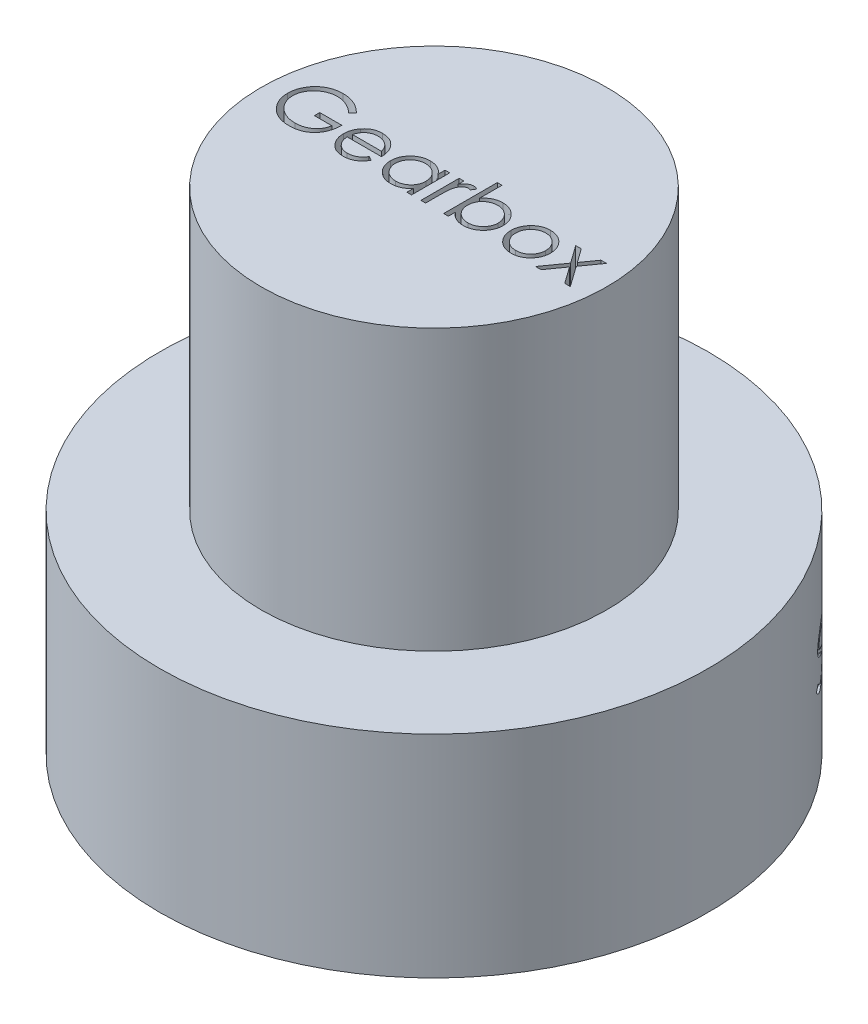
from build123d import *

# Parameters (mm, degrees)
SKETCH1_R           = 63
BOSS_EXTRUDE1_DEPTH = 102
CUT_EXTRUDE1_DEPTH  = 30
SKETCH3_R           = 100
BOSS_EXTRUDE2_DEPTH = 77
SKETCH4_W           = 1.709615384
SKETCH4_H           = 13.921153846
SKETCH4_W_2         = 1.709615385
SKETCH4_H_2         = 19.538461538
CUT_EXTRUDE2_DEPTH  = 77


with BuildPart() as part:
    # Sketch1 → Boss-Extrude1 (new body)
    with BuildSketch(Plane(origin=(0, 0, 0), x_dir=(1, 0, 0), z_dir=(0, 1, 0))):
        Circle(SKETCH1_R)
    extrude(amount=BOSS_EXTRUDE1_DEPTH)

    # Sketch2 → Cut-Extrude1 (cut)
    # profile 1 of 7: a face of its own
    with BuildSketch(Plane(origin=(0, 102, 0), x_dir=(1, 0, 0), z_dir=(0, 1, 0))):
        with BuildLine():
            Line((-37.511465374, 9.23755467), (-38.97684999, 7.84849217))
            add(Edge.make_bspline(
                [(-38.97684999, 7.84849217), (-39.242019938, 8.09794301), (-39.766036706, 8.590896392), (-40.620348883, 9.230491952), (-41.511690948, 9.778403154), (-42.435411824, 10.224207098), (-43.368636239, 10.579912837), (-44.29897715, 10.833158858), (-45.21689161, 10.99466224), (-45.827401756, 11.013975508), (-46.128232201, 11.02349217)],
                knots=[0, 0, 0, 0, 1.08915593, 2.152340314, 3.188132944, 4.216796309, 5.218260357, 6.173443236, 7.099959455, 8, 8, 8, 8], degree=3))
            add(Edge.make_bspline(
                [(-46.128232201, 11.02349217), (-46.312825068, 11.021240972), (-46.681532052, 11.016744415), (-47.229202919, 10.959353758), (-47.7711299, 10.876813569), (-48.306289983, 10.757387063), (-48.835723699, 10.606026325), (-49.357589698, 10.416694018), (-49.872861471, 10.195957617), (-50.376685427, 9.940891867), (-50.865130168, 9.660694418), (-51.326449516, 9.350187361), (-51.763583873, 9.019322662), (-52.168317045, 8.659816616), (-52.542977132, 8.274925707), (-52.896481842, 7.871809712), (-53.216398267, 7.439455165), (-53.505365893, 6.985816829), (-53.763148416, 6.518862199), (-53.990706945, 6.043085784), (-54.181735382, 5.560065662), (-54.33288056, 5.069195725), (-54.457579976, 4.574273514), (-54.545305809, 4.071872107), (-54.59476354, 3.561453562), (-54.603318514, 3.219657056), (-54.607619221, 3.047831112)],
                knots=[0, 0, 0, 0, 1.02818874, 2.053710826, 3.065248034, 4.081641283, 5.106893873, 6.131558223, 7.173050175, 8.228653731, 9.27666206, 10.308777013, 11.325269123, 12.329503258, 13.32196095, 14.316845687, 15.314881793, 16.315733098, 17.311955233, 18.285320748, 19.252783886, 20.203351036, 21.145449891, 22.095197417, 23.042428769, 24, 24, 24, 24], degree=3))
            add(Edge.make_bspline(
                [(-54.607619221, 3.047831112), (-54.603505954, 2.872185664), (-54.595290653, 2.521374397), (-54.542710913, 1.997803802), (-54.445130062, 1.482009255), (-54.314677246, 0.972295845), (-54.15149595, 0.467790624), (-53.948081867, -0.02931918), (-53.707150527, -0.519015166), (-53.428277294, -0.996885052), (-53.122463815, -1.462374651), (-52.779873617, -1.900848619), (-52.415961013, -2.318145821), (-52.017468215, -2.70500105), (-51.597173278, -3.071761971), (-51.142519033, -3.408323883), (-50.662445641, -3.721169642), (-50.156220674, -4.006356411), (-49.629336958, -4.261128584), (-49.08909663, -4.487681504), (-48.533773805, -4.67425904), (-47.96628688, -4.826322149), (-47.387312359, -4.950965195), (-46.793911375, -5.031151981), (-46.190447063, -5.089340647), (-45.783655365, -5.093595165), (-45.578712971, -5.095738599)],
                knots=[0, 0, 0, 0, 0.93586088, 1.869166235, 2.799637598, 3.729985548, 4.670839027, 5.622275134, 6.589130586, 7.576015415, 8.568469353, 9.55398029, 10.53834874, 11.515998671, 12.510579167, 13.508179873, 14.527009472, 15.561807829, 16.601455013, 17.643573243, 18.680854198, 19.719860599, 20.772568776, 21.833555941, 22.908541556, 24, 24, 24, 24], degree=3))
            add(Edge.make_bspline(
                [(-45.578712971, -5.095738599), (-45.331725109, -5.090575634), (-44.846724316, -5.080437313), (-44.133783821, -5.001514309), (-43.449055679, -4.878251046), (-42.794463915, -4.697733809), (-42.169248245, -4.467480949), (-41.571116665, -4.189920346), (-41.004778351, -3.854405981), (-40.468530792, -3.475725362), (-39.974552397, -3.053823202), (-39.529032093, -2.598558382), (-39.13907593, -2.112140762), (-38.798871781, -1.59743526), (-38.517428963, -1.050181529), (-38.286418892, -0.473061439), (-38.109344834, 0.134184591), (-38.036655614, 0.553783329), (-37.999926913, 0.765799862)],
                knots=[0, 0, 0, 0, 1.13008108, 2.219097802, 3.278683437, 4.311054135, 5.322181354, 6.324827112, 7.324222904, 8.330512327, 9.32562643, 10.293043162, 11.24128371, 12.174520618, 13.111833804, 14.052305215, 15.015860969, 16, 16, 16, 16], degree=3))
            Line((-37.999926913, 0.765799862), (-44.349926913, 0.765799862))
            Line((-44.349926913, 0.765799862), (-44.349926913, 2.719646016))
            Line((-44.349926913, 2.719646016), (-36.290311528, 2.719646016))
            add(Edge.make_bspline(
                [(-36.290311528, 2.719646016), (-36.299596217, 2.355478113), (-36.317768031, 1.642735742), (-36.445233843, 0.60331184), (-36.651063717, -0.37842552), (-36.932243415, -1.303510238), (-37.296236012, -2.170631364), (-37.739135059, -2.980669293), (-38.268029033, -3.728390942), (-38.864078721, -4.419900519), (-39.533005634, -5.036735231), (-40.256734837, -5.578876121), (-41.036462051, -6.035546071), (-41.871449717, -6.407079105), (-42.758964362, -6.697041848), (-43.701059686, -6.902627144), (-44.696458113, -7.025798802), (-45.37864774, -7.041536167), (-45.727541096, -7.049584753)],
                knots=[0, 0, 0, 0, 1.140356446, 2.231883559, 3.274166699, 4.278491846, 5.25512956, 6.21435461, 7.1637429, 8.11826594, 9.068280886, 10.0076534, 10.945064095, 11.891975133, 12.864533718, 13.863980011, 14.907571808, 16, 16, 16, 16], degree=3))
            add(Edge.make_bspline(
                [(-45.727541096, -7.049584753), (-45.942589118, -7.046487108), (-46.366733127, -7.040377552), (-46.993156607, -6.99695799), (-47.602308228, -6.930116567), (-48.194099248, -6.82917811), (-48.77070651, -6.705545492), (-49.329250251, -6.547230637), (-49.871858161, -6.363976716), (-50.399368911, -6.155538836), (-50.906994516, -5.914030248), (-51.396995987, -5.645644924), (-51.8720819, -5.351766775), (-52.329016098, -5.027313458), (-52.770179381, -4.674711782), (-53.192727124, -4.293255023), (-53.59902486, -3.884109357), (-53.853535383, -3.593575033), (-53.981777874, -3.447180907)],
                knots=[0, 0, 0, 0, 1.107784379, 2.184907829, 3.233506516, 4.263428166, 5.276301166, 6.270063455, 7.25232949, 8.225834625, 9.190232166, 10.146266622, 11.1027726, 12.066435141, 13.031522626, 14.010570082, 14.99756817, 16, 16, 16, 16], degree=3))
            add(Edge.make_bspline(
                [(-53.981777874, -3.447180907), (-54.167847018, -3.214930638), (-54.53689675, -2.754285217), (-55.011939288, -2.01623409), (-55.416895495, -1.252046823), (-55.745468927, -0.45959606), (-56.002034797, 0.36037697), (-56.186037401, 1.206824484), (-56.293845646, 2.080836473), (-56.309377043, 2.672285985), (-56.317234605, 2.971508997)],
                knots=[0, 0, 0, 0, 1.023165419, 2.029347347, 3.013907458, 3.994755782, 4.975994455, 5.96558838, 6.970761222, 8, 8, 8, 8], degree=3))
            add(Edge.make_bspline(
                [(-56.317234605, 2.971508997), (-56.314337709, 3.195571029), (-56.308580734, 3.640847403), (-56.238773282, 4.301922176), (-56.138616993, 4.951258801), (-55.991403739, 5.588326486), (-55.805822641, 6.213550706), (-55.574210095, 6.827221767), (-55.304544304, 7.429701811), (-54.991114675, 8.016843864), (-54.642312117, 8.580856739), (-54.263760204, 9.119469926), (-53.850083465, 9.622874694), (-53.408037471, 10.09744638), (-52.932348138, 10.537222961), (-52.427471847, 10.946276049), (-51.893019509, 11.325154346), (-51.327309729, 11.667890161), (-50.73878619, 11.975757867), (-50.12885961, 12.245664862), (-49.497716178, 12.468731193), (-48.850084336, 12.657999908), (-48.181061939, 12.797963745), (-47.495503946, 12.899466202), (-46.789836908, 12.968920323), (-46.312846519, 12.974506086), (-46.070990615, 12.977338324)],
                knots=[0, 0, 0, 0, 1.008945113, 2.00506715, 2.99143336, 3.967273523, 4.948097931, 5.927297278, 6.919902385, 7.919676788, 8.923139349, 9.905703106, 10.883022732, 11.856032218, 12.825136022, 13.798837087, 14.781400844, 15.773989409, 16.776158564, 17.77167057, 18.775803737, 19.789618931, 20.80898985, 21.851988756, 22.910860228, 24, 24, 24, 24], degree=3))
            add(Edge.make_bspline(
                [(-46.070990615, 12.977338324), (-45.873751031, 12.974184233), (-45.482648116, 12.967930042), (-44.90066663, 12.9245796), (-44.32768065, 12.855869618), (-43.762840585, 12.76210668), (-43.208069935, 12.634397165), (-42.661788295, 12.481571072), (-42.123203777, 12.303634152), (-41.594004306, 12.091423432), (-41.070631595, 11.850557273), (-40.550175577, 11.579429931), (-40.034414538, 11.273405263), (-39.522454054, 10.931574591), (-39.011065741, 10.559808845), (-38.508338188, 10.147475277), (-38.002136448, 9.710834277), (-37.676643717, 9.39687839), (-37.511465374, 9.23755467)],
                knots=[0, 0, 0, 0, 0.985871117, 1.954866573, 2.915460327, 3.869826059, 4.81536089, 5.759505086, 6.70452669, 7.649098992, 8.607881297, 9.583363685, 10.581137262, 11.603961102, 12.659522466, 13.73993555, 14.853081303, 16, 16, 16, 16], degree=3))
        make_face()
    # profile 2 of 7: a face of its own
    with BuildSketch(Plane(origin=(0, 102, 0), x_dir=(1, 0, 0), z_dir=(0, 1, 0))):
        with BuildLine():
            Line((-21.445660086, -2.164969369), (-19.92684999, -2.962535474))
            add(Edge.make_bspline(
                [(-19.92684999, -2.962535474), (-20.047880601, -3.177219892), (-20.283358241, -3.594910751), (-20.688310884, -4.168761306), (-21.112810593, -4.685003874), (-21.576019333, -5.129846706), (-22.064078586, -5.517657816), (-22.579694892, -5.856953691), (-23.1255526, -6.146070208), (-23.701677531, -6.389651824), (-24.312907945, -6.576937785), (-24.960725056, -6.709222188), (-25.646369909, -6.790991693), (-26.116339831, -6.800490245), (-26.356988211, -6.805353984)],
                knots=[0, 0, 0, 0, 1.120438281, 2.179929193, 3.190490725, 4.156257408, 5.095198341, 6.022838206, 6.959905092, 7.901321166, 8.864066838, 9.862729781, 10.905609505, 12, 12, 12, 12], degree=3))
            add(Edge.make_bspline(
                [(-26.356988211, -6.805353984), (-26.624460974, -6.799110073), (-27.146222849, -6.78693001), (-27.905717758, -6.681923882), (-28.620797164, -6.51062433), (-29.291420863, -6.271326168), (-29.915946552, -5.958757447), (-30.495615491, -5.577977982), (-31.033476053, -5.130943853), (-31.512579249, -4.613782925), (-31.943892382, -4.060342557), (-32.32448863, -3.483639815), (-32.642664077, -2.885125693), (-32.901486141, -2.268610412), (-33.110518334, -1.637979791), (-33.256205679, -0.987495946), (-33.340187593, -0.318919409), (-33.353056932, 0.133367518), (-33.359542297, 0.361292651)],
                knots=[0, 0, 0, 0, 1.145258523, 2.234067595, 3.276747158, 4.290159414, 5.277019952, 6.260822364, 7.254936242, 8.264827045, 9.274100331, 10.257902744, 11.220704747, 12.172965371, 13.118907548, 14.062713208, 15.023725156, 16, 16, 16, 16], degree=3))
            add(Edge.make_bspline(
                [(-33.359542297, 0.361292651), (-33.353777542, 0.575168799), (-33.342352559, 0.999043081), (-33.270339274, 1.626416974), (-33.142713564, 2.236171837), (-32.96758243, 2.828814332), (-32.741424933, 3.403352175), (-32.464752425, 3.960135036), (-32.137133912, 4.49857044), (-31.884189788, 4.838221782), (-31.756777874, 5.009309478)],
                knots=[0, 0, 0, 0, 1.024358464, 2.0301432, 3.019427413, 4.004406732, 4.986367066, 5.972626655, 6.978780325, 8, 8, 8, 8], degree=3))
            add(Edge.make_bspline(
                [(-31.756777874, 5.009309478), (-31.584197487, 5.215424328), (-31.24450362, 5.621124832), (-30.669975457, 6.154189148), (-30.047855817, 6.600741696), (-29.38594111, 6.970894823), (-28.676538301, 7.252147101), (-27.929183445, 7.46173837), (-27.135366755, 7.579184402), (-26.592685481, 7.595773325), (-26.315011047, 7.604261401)],
                knots=[0, 0, 0, 0, 1.030682036, 2.02871468, 2.997146059, 3.962720338, 4.930598197, 5.918074684, 6.934738563, 8, 8, 8, 8], degree=3))
            add(Edge.make_bspline(
                [(-26.315011047, 7.604261401), (-26.029546224, 7.596891506), (-25.469529314, 7.582433453), (-24.652925913, 7.448395838), (-23.880254013, 7.235838362), (-23.151822811, 6.93564416), (-22.467558454, 6.548332885), (-21.83190867, 6.068589434), (-21.23400258, 5.511142416), (-20.886157315, 5.082445519), (-20.709151672, 4.864297458)],
                knots=[0, 0, 0, 0, 1.056321875, 2.072262726, 3.055038591, 4.01806755, 4.982017516, 5.957941055, 6.960871419, 8, 8, 8, 8], degree=3))
            add(Edge.make_bspline(
                [(-20.709151672, 4.864297458), (-20.588717908, 4.69990368), (-20.348652023, 4.372210377), (-20.04794995, 3.837878793), (-19.7869247, 3.278839701), (-19.578283869, 2.686056512), (-19.409340299, 2.066552797), (-19.287111042, 1.415899804), (-19.21543069, 0.734291286), (-19.20134078, 0.269871035), (-19.194157682, 0.033107555)],
                knots=[0, 0, 0, 0, 0.94817472, 1.890038105, 2.849395472, 3.817997239, 4.812318967, 5.836947057, 6.897266129, 8, 8, 8, 8], degree=3))
            Line((-19.194157682, 0.033107555), (-31.649926913, 0.033107555))
            add(Edge.make_bspline(
                [(-31.649926913, 0.033107555), (-31.641547055, -0.150319258), (-31.625068402, -0.511020687), (-31.548241695, -1.038818806), (-31.427144797, -1.541593712), (-31.256951757, -2.015574269), (-31.050847927, -2.466951105), (-30.798377097, -2.892375907), (-30.497171811, -3.289910926), (-30.161207647, -3.663112061), (-29.787244742, -3.995457061), (-29.393820075, -4.292918871), (-28.975299386, -4.542232191), (-28.534982674, -4.744597019), (-28.073581958, -4.903018539), (-27.590951868, -5.011156249), (-27.08804212, -5.083584931), (-26.745219768, -5.091638537), (-26.570690134, -5.095738599)],
                knots=[0, 0, 0, 0, 1.094153842, 2.151609401, 3.174256925, 4.172055639, 5.149267565, 6.128595816, 7.11444997, 8.118368179, 9.117203808, 10.09244225, 11.054858984, 12.015122123, 12.976791628, 13.957293641, 14.960065497, 16, 16, 16, 16], degree=3))
            add(Edge.make_bspline(
                [(-26.570690134, -5.095738599), (-26.400050316, -5.092429034), (-26.061468184, -5.085862221), (-25.557237232, -5.022007106), (-25.061177804, -4.918754606), (-24.575343024, -4.777839088), (-24.109593134, -4.605970793), (-23.678270926, -4.398582382), (-23.281594324, -4.169167332), (-22.910843406, -3.906768958), (-22.551228428, -3.585595826), (-22.194490037, -3.184807116), (-21.811984252, -2.710802143), (-21.572555183, -2.354046447), (-21.445660086, -2.164969369)],
                knots=[0, 0, 0, 0, 0.99110716, 1.966546729, 2.947904876, 3.932708344, 4.903319531, 5.828989031, 6.710028674, 7.56322171, 8.463672341, 9.504779593, 10.677557249, 12, 12, 12, 12], degree=3))
        make_face()
        with BuildLine():
            add(Edge.make_bspline(
                [(-20.903773067, 1.742722939), (-20.966347552, 1.969488009), (-21.086783293, 2.405937772), (-21.338441219, 3.010317476), (-21.621859176, 3.547461623), (-21.957257457, 4.01325934), (-22.337270807, 4.426935604), (-22.776211015, 4.788442474), (-23.268440664, 5.111843172), (-23.811415415, 5.384816062), (-24.38640856, 5.617170865), (-24.988422262, 5.77297328), (-25.602691079, 5.879705218), (-26.018167694, 5.889644465), (-26.227240615, 5.894646016)],
                knots=[0, 0, 0, 0, 1.154881502, 2.222775134, 3.210006277, 4.132804581, 5.035138423, 5.962687519, 6.919655026, 7.923214229, 8.944639381, 9.960483929, 10.97369054, 12, 12, 12, 12], degree=3))
            add(Edge.make_bspline(
                [(-26.227240615, 5.894646016), (-26.39787113, 5.891316775), (-26.735171786, 5.884735566), (-27.232110457, 5.822305291), (-27.709338532, 5.719109564), (-28.170377312, 5.577786014), (-28.609185181, 5.389416335), (-29.034788134, 5.16852763), (-29.436364291, 4.898879867), (-29.68750477, 4.693363814), (-29.814380038, 4.589537843)],
                knots=[0, 0, 0, 0, 1.04873581, 2.073130211, 3.073294108, 4.04793562, 5.032784715, 6.005352987, 6.992311501, 8, 8, 8, 8], degree=3))
            add(Edge.make_bspline(
                [(-29.814380038, 4.589537843), (-29.905239187, 4.507381639), (-30.08911596, 4.341117506), (-30.33480937, 4.054664253), (-30.570052229, 3.745773608), (-30.784139681, 3.402628001), (-30.980504831, 3.029134904), (-31.164255563, 2.628444632), (-31.329644464, 2.197516595), (-31.422696148, 1.89722089), (-31.470569942, 1.742722939)],
                knots=[0, 0, 0, 0, 0.879870761, 1.780643979, 2.707998968, 3.669668524, 4.684282772, 5.740141944, 6.837334558, 8, 8, 8, 8], degree=3))
            Line((-31.470569942, 1.742722939), (-20.903773067, 1.742722939))
        make_face(mode=Mode.SUBTRACT)
    # profile 3 of 7: a face of its own
    with BuildSketch(Plane(origin=(0, 102, 0), x_dir=(1, 0, 0), z_dir=(0, 1, 0))):
        with BuildLine():
            Line((-1.609542297, 7.360030631), (-1.609542297, -6.561123215))
            Line((-1.609542297, -6.561123215), (-3.319157682, -6.561123215))
            Line((-3.319157682, -6.561123215), (-3.319157682, -4.153160474))
            add(Edge.make_bspline(
                [(-3.319157682, -4.153160474), (-3.5119371, -4.371090264), (-3.888148557, -4.79638299), (-4.516478071, -5.352001671), (-5.182510582, -5.811260822), (-5.883013487, -6.182191077), (-6.617354211, -6.460822127), (-7.383904915, -6.658866793), (-8.182978288, -6.786196096), (-8.728637533, -6.798910729), (-9.005155278, -6.805353984)],
                knots=[0, 0, 0, 0, 1.074387032, 2.096679803, 3.090159297, 4.057316773, 5.018401886, 5.985159533, 6.978961417, 8, 8, 8, 8], degree=3))
            add(Edge.make_bspline(
                [(-9.005155278, -6.805353984), (-9.250997998, -6.798679015), (-9.735810728, -6.78551568), (-10.448983276, -6.683395142), (-11.135285377, -6.519398473), (-11.795365551, -6.291337917), (-12.424952514, -5.988819445), (-13.029436754, -5.626644938), (-13.605686692, -5.19534842), (-14.144918926, -4.702290723), (-14.641481671, -4.166740864), (-15.07724374, -3.595537245), (-15.440571218, -2.991149848), (-15.744391943, -2.361230824), (-15.978414903, -1.700931048), (-16.141557113, -1.012533891), (-16.243558687, -0.296853294), (-16.25671658, 0.190497539), (-16.263388451, 0.437614766)],
                knots=[0, 0, 0, 0, 1.033919861, 2.038935746, 3.024066025, 3.998881131, 4.97069526, 5.957263378, 6.95902576, 7.993208707, 9.027059324, 10.027763471, 11.009749337, 11.988697705, 12.965288445, 13.950418724, 14.960734635, 16, 16, 16, 16], degree=3))
            add(Edge.make_bspline(
                [(-16.263388451, 0.437614766), (-16.256568707, 0.679624353), (-16.243086441, 1.15806425), (-16.142648201, 1.861709735), (-15.973750854, 2.539444839), (-15.73672614, 3.18908763), (-15.432786357, 3.811424189), (-15.063063483, 4.406894668), (-14.627530819, 4.977139531), (-14.125414146, 5.508750066), (-13.581483469, 5.999807981), (-12.999594519, 6.426577214), (-12.394222088, 6.795150348), (-11.755976273, 7.087178555), (-11.094303889, 7.32344811), (-10.40331442, 7.486913265), (-9.685882827, 7.583237256), (-9.198798863, 7.597186015), (-8.951729797, 7.604261401)],
                knots=[0, 0, 0, 0, 1.020392517, 2.01726096, 2.990465484, 3.961182959, 4.928053699, 5.906110375, 6.912531644, 7.948652711, 8.985773172, 9.998621852, 10.987621588, 11.969261332, 12.953316658, 13.946091881, 14.958173133, 16, 16, 16, 16], degree=3))
            add(Edge.make_bspline(
                [(-8.951729797, 7.604261401), (-8.667613422, 7.596435924), (-8.110474618, 7.581090535), (-7.295526453, 7.453386262), (-6.524575795, 7.237639748), (-5.791671393, 6.944174509), (-5.099445088, 6.554200712), (-4.454450273, 6.062275495), (-3.849936714, 5.47150132), (-3.499523983, 5.017727901), (-3.319157682, 4.784159237)],
                knots=[0, 0, 0, 0, 1.038897134, 2.037228247, 3.008116434, 3.962042015, 4.918381754, 5.904844433, 6.921570401, 8, 8, 8, 8], degree=3))
            Line((-3.319157682, 4.784159237), (-3.319157682, 7.360030631))
            Line((-3.319157682, 7.360030631), (-1.609542297, 7.360030631))
        make_face()
        with BuildLine():
            add(Edge.make_bspline(
                [(-8.928833163, 5.894646016), (-9.178738345, 5.885754359), (-9.672011425, 5.868203643), (-10.396150921, 5.731187905), (-11.089099647, 5.503216041), (-11.747391851, 5.191438836), (-12.360628859, 4.799396713), (-12.908690124, 4.325207469), (-13.396058256, 3.781808864), (-13.80595038, 3.171653092), (-14.140090084, 2.51754091), (-14.375042072, 1.83378504), (-14.529996119, 1.132717948), (-14.545826781, 0.65721533), (-14.553773067, 0.418534237)],
                knots=[0, 0, 0, 0, 1.031046209, 2.035121221, 3.029706178, 4.034933723, 5.034054252, 6.02443088, 7.017295772, 8.038157696, 9.050218397, 10.03989886, 11.016116709, 12, 12, 12, 12], degree=3))
            add(Edge.make_bspline(
                [(-14.553773067, 0.418534237), (-14.543622719, 0.181279511), (-14.523361809, -0.292299983), (-14.377761601, -0.994322837), (-14.133486861, -1.678239837), (-13.800155063, -2.338246102), (-13.38276072, -2.951025277), (-12.898952482, -3.504782229), (-12.344051665, -3.98097556), (-11.729403377, -4.37959721), (-11.072951423, -4.70161036), (-10.382612454, -4.925669055), (-9.671363623, -5.070328118), (-9.187753063, -5.087225342), (-8.944097586, -5.095738599)],
                knots=[0, 0, 0, 0, 0.979072187, 1.954306742, 2.945804271, 3.96968567, 4.997920485, 5.998718438, 6.996577872, 8.005894225, 9.015743152, 10.005417472, 10.995077863, 12, 12, 12, 12], degree=3))
            add(Edge.make_bspline(
                [(-8.944097586, -5.095738599), (-8.696738764, -5.086703653), (-8.2047666, -5.06873404), (-7.478478776, -4.931131725), (-6.773656192, -4.703790122), (-6.099899992, -4.388653447), (-5.472250764, -3.99808841), (-4.908926602, -3.540849814), (-4.432589688, -3.009065341), (-4.028769913, -2.424630646), (-3.712129431, -1.783941066), (-3.481482594, -1.10176497), (-3.345117764, -0.378078613), (-3.327930693, 0.116480761), (-3.319157682, 0.368924862)],
                knots=[0, 0, 0, 0, 1.01762866, 2.023962475, 3.030623092, 4.058876274, 5.077231937, 6.066672613, 7.034107872, 8.005628644, 8.981990164, 9.965428785, 10.961468474, 12, 12, 12, 12], degree=3))
            add(Edge.make_bspline(
                [(-3.319157682, 0.368924862), (-3.324380955, 0.561263625), (-3.334662008, 0.939847178), (-3.413205536, 1.495712667), (-3.538145922, 2.027663376), (-3.714201504, 2.536258583), (-3.945475495, 3.01868631), (-4.224409764, 3.47841049), (-4.555909426, 3.913040112), (-4.9346381, 4.316590256), (-5.349194417, 4.684671429), (-5.787858988, 5.013225368), (-6.255829025, 5.283129974), (-6.745234612, 5.506511751), (-7.256924875, 5.684270839), (-7.795063534, 5.802858143), (-8.353930592, 5.884285034), (-8.735181265, 5.891155992), (-8.928833163, 5.894646016)],
                knots=[0, 0, 0, 0, 1.050140795, 2.067009409, 3.05949893, 4.030605086, 5.00011959, 5.97591094, 6.962425594, 7.979863591, 8.993523472, 9.986985069, 10.967611495, 11.937549037, 12.921786183, 13.919465291, 14.943216303, 16, 16, 16, 16], degree=3))
        make_face(mode=Mode.SUBTRACT)
    # profile 4 of 7: a face of its own
    with BuildSketch(Plane(origin=(0, 102, 0), x_dir=(1, 0, 0), z_dir=(0, 1, 0))):
        with BuildLine():
            Line((1.809688472, 7.360030631), (3.519303856, 7.360030631))
            Line((3.519303856, 7.360030631), (3.519303856, 5.310781833))
            add(Edge.make_bspline(
                [(3.519303856, 5.310781833), (3.645516958, 5.501585699), (3.886898533, 5.866496609), (4.288107477, 6.349110948), (4.699061323, 6.748698559), (5.121727414, 7.067124854), (5.559213929, 7.3055934), (6.001919338, 7.480271205), (6.456808681, 7.583562021), (6.762490011, 7.597352365), (6.915637991, 7.604261401)],
                knots=[0, 0, 0, 0, 1.2804753, 2.448899062, 3.506932113, 4.484331642, 5.4025378, 6.288909075, 7.142734305, 8, 8, 8, 8], degree=3))
            add(Edge.make_bspline(
                [(6.915637991, 7.604261401), (7.034435568, 7.597781534), (7.278869303, 7.584448789), (7.648888828, 7.490772729), (8.03012533, 7.341213778), (8.275828895, 7.200569137), (8.403919241, 7.12724818)],
                knots=[0, 0, 0, 0, 0.901110191, 1.854092781, 2.881294221, 4, 4, 4, 4], degree=3))
            Line((8.403919241, 7.12724818), (7.465157222, 5.646599141))
            add(Edge.make_bspline(
                [(7.465157222, 5.646599141), (7.382920978, 5.683285447), (7.226820845, 5.752923078), (6.998468134, 5.835338876), (6.787931144, 5.883866932), (6.653799777, 5.891218694), (6.591269001, 5.894646016)],
                knots=[0, 0, 0, 0, 1.180555205, 2.24091978, 3.179933427, 4, 4, 4, 4], degree=3))
            add(Edge.make_bspline(
                [(6.591269001, 5.894646016), (6.454077794, 5.885501813), (6.1742475, 5.866850288), (5.763396153, 5.720226206), (5.364722078, 5.483324542), (5.04810203, 5.220591776), (4.802943482, 4.967238764), (4.628008826, 4.745995316), (4.467538446, 4.497917336), (4.314211961, 4.227245771), (4.174513988, 3.929359038), (4.044132145, 3.607233262), (3.926246049, 3.260495347), (3.859025434, 3.018927629), (3.824592318, 2.895186881)],
                knots=[0, 0, 0, 0, 1.125678352, 2.296057538, 3.5422874, 4.923748041, 5.663163013, 6.437101912, 7.23742474, 8.08941207, 8.991984279, 9.93940061, 10.944477711, 12, 12, 12, 12], degree=3))
            add(Edge.make_bspline(
                [(3.824592318, 2.895186881), (3.798834577, 2.784821122), (3.741783138, 2.540369353), (3.686312053, 2.130258097), (3.631505105, 1.64571504), (3.592879226, 1.085391441), (3.557075882, 0.450686568), (3.536882434, -0.259366508), (3.519992484, -1.045496605), (3.519540363, -1.595085584), (3.519303856, -1.882577542)],
                knots=[0, 0, 0, 0, 0.566838948, 1.255505196, 2.06880316, 3.007127437, 4.065329342, 5.249902469, 6.561414163, 8, 8, 8, 8], degree=3))
            Line((3.519303856, -1.882577542), (3.519303856, -6.561123215))
            Line((3.519303856, -6.561123215), (1.809688472, -6.561123215))
            Line((1.809688472, -6.561123215), (1.809688472, 7.360030631))
        make_face()
    # profile 5 of 7: a face of its own
    with BuildSketch(Plane(origin=(0, 102, 0), x_dir=(1, 0, 0), z_dir=(0, 1, 0))):
        with BuildLine():
            Line((10.113534626, -6.561123215), (10.113534626, 12.977338324))
            Line((10.113534626, 12.977338324), (11.82315001, 12.977338324))
            Line((11.82315001, 12.977338324), (11.82315001, 4.833768612))
            add(Edge.make_bspline(
                [(11.82315001, 4.833768612), (12.015791334, 5.055608213), (12.391642497, 5.488426419), (13.021797181, 6.053654341), (13.682590353, 6.532911396), (14.37904886, 6.92798727), (15.112163253, 7.228833616), (15.878148016, 7.44884691), (16.678961252, 7.581581339), (17.224984184, 7.596636681), (17.501515395, 7.604261401)],
                knots=[0, 0, 0, 0, 1.077089805, 2.101446609, 3.097517232, 4.067117542, 5.031729543, 5.997785507, 6.985986182, 8, 8, 8, 8], degree=3))
            add(Edge.make_bspline(
                [(17.501515395, 7.604261401), (17.747348231, 7.597511016), (18.233401643, 7.584164355), (18.947951616, 7.482739458), (19.635456728, 7.318268279), (20.295542753, 7.090255132), (20.925129646, 6.787724927), (21.529608228, 6.425550095), (22.10588153, 5.994267189), (22.64502312, 5.501153526), (23.141922701, 4.965812479), (23.576875078, 4.393331049), (23.944266281, 3.792030914), (24.248148031, 3.16392486), (24.483121905, 2.506447578), (24.645004816, 1.820243725), (24.747839243, 1.105988367), (24.760794584, 0.619871536), (24.767380779, 0.372740968)],
                knots=[0, 0, 0, 0, 1.034377878, 2.045141349, 3.03070803, 4.00595497, 4.978199603, 5.965204761, 6.967410914, 8.002051993, 9.036360596, 10.037508045, 11.022711142, 11.997267194, 12.969246472, 13.954813154, 14.960274251, 16, 16, 16, 16], degree=3))
            add(Edge.make_bspline(
                [(24.767380779, 0.372740968), (24.76065101, 0.129445157), (24.747380966, -0.350295866), (24.646027845, -1.056270122), (24.478680319, -1.735749327), (24.239405879, -2.386977699), (23.938606712, -3.013014656), (23.562443912, -3.606723712), (23.128044043, -4.178435851), (22.625498792, -4.709787331), (22.081683597, -5.200914837), (21.499764647, -5.62766676), (20.894399616, -5.996241371), (20.256153248, -6.288280307), (19.594475766, -6.524505322), (18.902278303, -6.688431611), (18.183477019, -6.784079239), (17.695149926, -6.798206539), (17.448089914, -6.805353984)],
                knots=[0, 0, 0, 0, 1.024244038, 2.01964794, 2.996620209, 3.965911562, 4.936179293, 5.91563013, 6.920572822, 7.955171681, 8.990768464, 10.002129126, 10.989675881, 11.969873457, 12.952483066, 13.943799762, 14.959703725, 16, 16, 16, 16], degree=3))
            add(Edge.make_bspline(
                [(17.448089914, -6.805353984), (17.165251232, -6.797512959), (16.610653891, -6.782138076), (15.799381528, -6.654671918), (15.031494809, -6.437710869), (14.298246438, -6.146181884), (13.610118404, -5.751418781), (12.962741805, -5.26179704), (12.360199162, -4.669248769), (12.005233353, -4.217156945), (11.82315001, -3.98525182)],
                knots=[0, 0, 0, 0, 1.035807596, 2.031038093, 2.998900396, 3.954262848, 4.914341711, 5.895762244, 6.92060972, 8, 8, 8, 8], degree=3))
            Line((11.82315001, -3.98525182), (11.82315001, -6.561123215))
            Line((11.82315001, -6.561123215), (10.113534626, -6.561123215))
        make_face()
        with BuildLine():
            add(Edge.make_bspline(
                [(17.432825491, -5.095738599), (17.682730753, -5.086846991), (18.17600399, -5.069296369), (18.900142334, -4.932279935), (19.593095389, -4.704310687), (20.251371308, -4.392523645), (20.864668707, -4.000517999), (21.412506614, -3.526193842), (21.89953189, -2.984621313), (22.305850842, -2.373749354), (22.645083687, -1.723594793), (22.878110234, -1.039676381), (23.034427574, -0.340297601), (23.049952227, 0.13402587), (23.057765395, 0.372740968)],
                knots=[0, 0, 0, 0, 1.031910345, 2.036826888, 3.032245421, 4.038315463, 5.03827337, 6.029480047, 7.023177075, 8.037597977, 9.052889626, 10.043399556, 11.015292101, 12, 12, 12, 12], degree=3))
            add(Edge.make_bspline(
                [(23.057765395, 0.372740968), (23.047490675, 0.611222703), (23.026982253, 1.087234093), (22.88342808, 1.79289871), (22.632742109, 2.47645421), (22.300085439, 3.136008691), (21.887146834, 3.751094005), (21.402700089, 4.303490267), (20.848171974, 4.780066753), (20.234090219, 5.177341284), (19.57996661, 5.501515422), (18.891496161, 5.723829061), (18.183064093, 5.869361195), (17.701940054, 5.886174879), (17.459538231, 5.894646016)],
                knots=[0, 0, 0, 0, 0.984795267, 1.965658976, 2.959410029, 3.983795688, 5.009594896, 6.01088574, 7.009236619, 8.019050059, 9.024672985, 10.014834719, 10.999826153, 12, 12, 12, 12], degree=3))
            add(Edge.make_bspline(
                [(17.459538231, 5.894646016), (17.212065084, 5.886179666), (16.720881101, 5.869375678), (15.99606549, 5.723573379), (15.288149617, 5.500157093), (14.611670337, 5.179402178), (13.981093264, 4.7869098), (13.417144617, 4.325681), (12.930925711, 3.798921786), (12.530637473, 3.208340208), (12.212748496, 2.5705188), (11.985325524, 1.890095237), (11.849256019, 1.170651236), (11.831957898, 0.677347645), (11.82315001, 0.426166449)],
                knots=[0, 0, 0, 0, 1.016820015, 2.018181405, 3.029022337, 4.06341356, 5.088169224, 6.076823655, 7.05054209, 8.02560866, 9.001194327, 9.972267242, 10.967515442, 12, 12, 12, 12], degree=3))
            add(Edge.make_bspline(
                [(11.82315001, 0.426166449), (11.828373359, 0.233827751), (11.838654563, -0.144755672), (11.917196998, -0.700622102), (12.042141386, -1.232569362), (12.218182403, -1.741177123), (12.449510552, -2.223558173), (12.728240712, -2.683458265), (13.059991816, -3.116727538), (13.435040539, -3.522303782), (13.848492926, -3.891380737), (14.292211614, -4.211302219), (14.757129209, -4.486788025), (15.248564622, -4.70637924), (15.760798932, -4.885593588), (16.299088475, -5.003887261), (16.857914369, -5.085394258), (17.239170712, -5.092254181), (17.432825491, -5.095738599)],
                knots=[0, 0, 0, 0, 1.050331198, 2.067384183, 3.060053655, 4.031335885, 5.001026174, 5.976994447, 6.963687968, 7.976578778, 8.990422448, 9.985569286, 10.960374351, 11.936812464, 12.921228065, 13.919088064, 14.943024695, 16, 16, 16, 16], degree=3))
        make_face(mode=Mode.SUBTRACT)
    # profile 6 of 7: a face of its own
    with BuildSketch(Plane(origin=(0, 102, 0), x_dir=(1, 0, 0), z_dir=(0, 1, 0))):
        with BuildLine():
            add(Edge.make_bspline(
                [(34.910589914, 7.604261401), (35.171799556, 7.598699393), (35.683967828, 7.587793656), (36.434036464, 7.471235057), (37.150017847, 7.292995831), (37.834654121, 7.046589186), (38.479177101, 6.716305998), (39.092974872, 6.32219257), (39.674364592, 5.855290168), (40.022832794, 5.494112682), (40.19971251, 5.310781833)],
                knots=[0, 0, 0, 0, 1.054011418, 2.066658804, 3.057071809, 4.030435133, 4.997543892, 5.974964718, 6.972108034, 8, 8, 8, 8], degree=3))
            add(Edge.make_bspline(
                [(40.19971251, 5.310781833), (40.352014289, 5.135445711), (40.653670387, 4.788166702), (41.040470942, 4.22507258), (41.373691148, 3.641924319), (41.640733836, 3.030978155), (41.851290893, 2.397567445), (42.000782754, 1.73951507), (42.089702357, 1.058274294), (42.101692792, 0.595610547), (42.107765395, 0.361292651)],
                knots=[0, 0, 0, 0, 1.025258237, 2.030674902, 3.01204498, 3.988269485, 4.97094183, 5.956517959, 6.965070386, 8, 8, 8, 8], degree=3))
            add(Edge.make_bspline(
                [(42.107765395, 0.361292651), (42.102424116, 0.125616622), (42.0918695, -0.3400902), (41.992027816, -1.025995606), (41.836737192, -1.691084569), (41.61449533, -2.332572602), (41.329517621, -2.952420563), (40.981769736, -3.54792111), (40.568811362, -4.120249149), (40.100703894, -4.664544869), (39.583350111, -5.166192409), (39.022103647, -5.603407705), (38.427993835, -5.977993431), (37.793120726, -6.279725921), (37.123281976, -6.517631576), (36.417032791, -6.68472738), (35.675470337, -6.785755973), (35.169136461, -6.798729422), (34.910589914, -6.805353984)],
                knots=[0, 0, 0, 0, 0.998656419, 1.973391657, 2.932242238, 3.890759089, 4.846373663, 5.82037756, 6.809684879, 7.83454468, 8.860553229, 9.859544525, 10.845671541, 11.83227036, 12.833544569, 13.85385346, 14.904124723, 16, 16, 16, 16], degree=3))
            add(Edge.make_bspline(
                [(34.910589914, -6.805353984), (34.650776655, -6.798707187), (34.141919261, -6.785689101), (33.397739274, -6.68511989), (32.690224348, -6.517708585), (32.019508691, -6.278944089), (31.381906024, -5.977983787), (30.784353804, -5.604540162), (30.222651407, -5.166062746), (29.705188178, -4.664580002), (29.237110054, -4.120240097), (28.824144109, -3.547923459), (28.476398191, -2.952419951), (28.191419967, -2.332572765), (27.969178242, -1.691084525), (27.813887581, -1.025995617), (27.714045907, -0.340090197), (27.70349129, 0.125616623), (27.69815001, 0.361292651)],
                knots=[0, 0, 0, 0, 1.099876186, 2.154163076, 3.173186993, 4.173200201, 5.163417411, 6.152872554, 7.150605724, 8.17532212, 9.198891216, 10.186952605, 11.159729845, 12.11414092, 13.071450619, 14.029093627, 15.002601286, 16, 16, 16, 16], degree=3))
            add(Edge.make_bspline(
                [(27.69815001, 0.361292651), (27.704264028, 0.594336993), (27.716368732, 1.055724741), (27.805198932, 1.735684885), (27.954107646, 2.392623531), (28.164917104, 3.023589336), (28.434421215, 3.63185821), (28.762959082, 4.216447361), (29.153705239, 4.776995247), (29.454161575, 5.123825425), (29.606202895, 5.299333516)],
                knots=[0, 0, 0, 0, 1.031353054, 2.041901799, 3.029428768, 4.008703097, 4.981709435, 5.96992636, 6.972712378, 8, 8, 8, 8], degree=3))
            add(Edge.make_bspline(
                [(29.606202895, 5.299333516), (29.78281594, 5.484254257), (30.130156571, 5.847933432), (30.71444036, 6.313474742), (31.326728158, 6.715789372), (31.978373827, 7.039509916), (32.662447668, 7.294445277), (33.382098117, 7.471694724), (34.134711994, 7.587373699), (34.649386503, 7.598576066), (34.910589914, 7.604261401)],
                knots=[0, 0, 0, 0, 1.027980169, 2.021703884, 2.998553061, 3.971491411, 4.943284454, 5.930300938, 6.949603206, 8, 8, 8, 8], degree=3))
        make_face()
        with BuildLine():
            add(Edge.make_bspline(
                [(34.902957703, 5.894646016), (34.718240132, 5.889395881), (34.353573446, 5.879031143), (33.816801135, 5.800197319), (33.30005544, 5.675297333), (32.802355989, 5.497838112), (32.32538115, 5.26869982), (31.86867426, 4.987258602), (31.43089198, 4.657242082), (31.020598178, 4.279166683), (30.644048736, 3.866168156), (30.314875749, 3.426122088), (30.034976242, 2.966166118), (29.801803376, 2.48582194), (29.62813711, 1.980221802), (29.502009659, 1.455091509), (29.423250207, 0.90936117), (29.412982918, 0.538370485), (29.407765395, 0.349844333)],
                knots=[0, 0, 0, 0, 1.021534396, 2.016698045, 2.994645724, 3.958388632, 4.93408049, 5.916473867, 6.921342795, 7.962252576, 8.998418191, 10.008913653, 10.997312074, 11.973003931, 12.956656626, 13.948281152, 14.957379055, 16, 16, 16, 16], degree=3))
            add(Edge.make_bspline(
                [(29.407765395, 0.349844333), (29.416511106, 0.106265443), (29.433869708, -0.377193107), (29.575031495, -1.089179361), (29.811176819, -1.772703441), (30.130059012, -2.423758343), (30.529598574, -3.026131742), (31.000335323, -3.563186535), (31.53721712, -4.026840737), (32.133844071, -4.411546482), (32.778029716, -4.71721601), (33.459781978, -4.933836149), (34.170840613, -5.074652075), (34.656782878, -5.088648242), (34.902957703, -5.095738599)],
                knots=[0, 0, 0, 0, 1.016792936, 2.018143844, 3.017858371, 4.030088057, 5.03801393, 6.028138512, 7.003788237, 7.991172063, 8.984598303, 9.972568034, 10.972917682, 12, 12, 12, 12], degree=3))
            add(Edge.make_bspline(
                [(34.902957703, -5.095738599), (35.149118368, -5.088606931), (35.635032683, -5.074529216), (36.345103345, -4.934545354), (37.024992249, -4.716266858), (37.668508802, -4.411890259), (38.264864172, -4.02537983), (38.805607246, -3.565804692), (39.272324687, -3.024709301), (39.671469022, -2.422960465), (39.995573436, -1.773712777), (40.230613434, -1.089053207), (40.37211458, -0.377225236), (40.389427377, 0.106254679), (40.39815001, 0.349844333)],
                knots=[0, 0, 0, 0, 1.02726834, 2.027799167, 3.010890988, 4.004497153, 4.992059811, 5.971914811, 6.958719428, 7.966827853, 8.981595046, 9.981490638, 10.983022906, 12, 12, 12, 12], degree=3))
            add(Edge.make_bspline(
                [(40.39815001, 0.349844333), (40.392934283, 0.538371612), (40.382670529, 0.909364514), (40.303885366, 1.455078726), (40.177853071, 1.980268702), (40.003836126, 2.485648891), (39.771676422, 2.967409808), (39.486379306, 3.424771608), (39.158550439, 3.867692523), (38.777457252, 4.277831625), (38.367591724, 4.657389467), (37.929632016, 4.987386572), (37.473602347, 5.267462913), (36.998013204, 5.499798022), (36.500249943, 5.673682832), (35.984228283, 5.800918498), (35.449746189, 5.878697996), (35.086386254, 5.889296009), (34.902957703, 5.894646016)],
                knots=[0, 0, 0, 0, 1.042956736, 2.052379634, 3.044323526, 4.02829302, 5.004299113, 5.996692471, 7.007513377, 8.048758398, 9.090003419, 10.095195979, 11.07790575, 12.047570684, 13.018257071, 13.989683339, 14.985167495, 16, 16, 16, 16], degree=3))
        make_face(mode=Mode.SUBTRACT)
    # profile 7 of 7: a face of its own
    with BuildSketch(Plane(origin=(0, 102, 0), x_dir=(1, 0, 0), z_dir=(0, 1, 0))):
        Polygon((44.305842318, 7.360030631), (46.339826693, 7.360030631), (49.92315001, 2.338035439), (53.506473328, 7.360030631), (55.540457703, 7.360030631), (50.942050251, 0.914627987), (56.27315001, -6.561123215), (54.239165635, -6.561123215), (49.92315001, -0.51259557), (45.607134385, -6.561123215), (43.57315001, -6.561123215), (48.908065876, 0.914627987), align=None)
    extrude(amount=-CUT_EXTRUDE1_DEPTH, mode=Mode.SUBTRACT)

    # Sketch3 → Boss-Extrude2 (add)
    with BuildSketch(Plane.XZ):
        Circle(SKETCH3_R)
    extrude(amount=BOSS_EXTRUDE2_DEPTH)

    # Sketch4 → Cut-Extrude2 (cut)
    # profile 1 of 14: a face of its own
    with BuildSketch(Plane.XY.offset(-100)):
        with BuildLine():
            Line((81.585795579, -45.823629693), (79.975398944, -44.858154934))
            add(Edge.make_bspline(
                [(79.975398944, -44.858154934), (79.82562111, -45.1088768), (79.53865256, -45.589250221), (79.059945876, -46.238354698), (78.56392246, -46.790054437), (78.046909087, -47.241139973), (77.51206157, -47.596280342), (76.955888363, -47.847752489), (76.380263707, -48.004593726), (75.988520479, -48.023644197), (75.792947021, -48.033154934)],
                knots=[0, 0, 0, 0, 1.272034388, 2.437168799, 3.508375237, 4.49857839, 5.41946034, 6.295179144, 7.148887113, 8, 8, 8, 8], degree=3))
            add(Edge.make_bspline(
                [(75.792947021, -48.033154934), (75.625922823, -48.028503073), (75.294796958, -48.019280749), (74.807322465, -47.930666669), (74.333892941, -47.794529225), (73.884265927, -47.599561012), (73.464645511, -47.363675825), (73.096671926, -47.078763059), (72.778558081, -46.759777854), (72.518339901, -46.403909405), (72.318695709, -46.02118321), (72.165250308, -45.628339818), (72.080096407, -45.219208039), (72.067268934, -44.94374252), (72.060795579, -44.804729453)],
                knots=[0, 0, 0, 0, 1.095163259, 2.171163733, 3.241058638, 4.321873601, 5.38011039, 6.391990106, 7.366004449, 8.327778327, 9.272591725, 10.192022065, 11.087607919, 12, 12, 12, 12], degree=3))
            add(Edge.make_bspline(
                [(72.060795579, -44.804729453), (72.068820041, -44.646119971), (72.085132601, -44.323690071), (72.223008228, -43.847986246), (72.439901986, -43.377219543), (72.639995804, -43.086019798), (72.743878511, -42.934837626)],
                knots=[0, 0, 0, 0, 0.938893495, 1.908633276, 2.914225137, 4, 4, 4, 4], degree=3))
            add(Edge.make_bspline(
                [(72.743878511, -42.934837626), (72.829171426, -42.825725629), (73.00823323, -42.59665864), (73.316067692, -42.255689572), (73.677288971, -41.903980749), (74.079535463, -41.528102168), (74.537459846, -41.145535731), (75.036719603, -40.73803839), (75.590061464, -40.321106949), (75.978134439, -40.041493414), (76.178373704, -39.897217434)],
                knots=[0, 0, 0, 0, 0.722233717, 1.516239348, 2.393582979, 3.351407094, 4.387010283, 5.505090956, 6.712668013, 8, 8, 8, 8], degree=3))
            add(Edge.make_bspline(
                [(76.178373704, -39.897217434), (76.378801454, -39.754458978), (76.762004051, -39.481515682), (77.297900049, -39.076434936), (77.777113484, -38.706081875), (78.197514417, -38.366970038), (78.558917937, -38.059053432), (78.864171931, -37.785288935), (79.105500363, -37.538272696), (79.239697166, -37.378027679), (79.299948223, -37.306081616)],
                knots=[0, 0, 0, 0, 1.452282411, 2.77665338, 3.964542531, 5.026858415, 5.96415736, 6.766646006, 7.446254459, 8, 8, 8, 8], degree=3))
            add(Edge.make_bspline(
                [(79.299948223, -37.306081616), (79.384163076, -37.193953116), (79.549782888, -36.973437371), (79.768400717, -36.628769217), (79.954215303, -36.275945443), (80.099878854, -35.914017952), (80.222540274, -35.548067839), (80.305042725, -35.173320345), (80.356703043, -34.791457007), (80.361993427, -34.534480668), (80.364641733, -34.405841232)],
                knots=[0, 0, 0, 0, 1.068054152, 2.10047183, 3.106115577, 4.101338837, 5.06977816, 6.043150881, 7.020423561, 8, 8, 8, 8], degree=3))
            add(Edge.make_bspline(
                [(80.364641733, -34.405841232), (80.357537667, -34.204293459), (80.343481379, -33.805505855), (80.224606563, -33.222952335), (80.036975528, -32.666766264), (79.774113353, -32.142454019), (79.435255475, -31.663667751), (79.043119528, -31.224900058), (78.576059868, -30.856045346), (78.063600589, -30.533762571), (77.502679479, -30.281508321), (76.914900419, -30.091220701), (76.299329212, -29.983401741), (75.882389294, -29.967928978), (75.670831636, -29.960078011)],
                knots=[0, 0, 0, 0, 1.005424448, 1.989358655, 2.955360095, 3.929531133, 4.905563448, 5.876582895, 6.856512386, 7.866279853, 8.892233794, 9.918561126, 10.94386622, 12, 12, 12, 12], degree=3))
            add(Edge.make_bspline(
                [(75.670831636, -29.960078011), (75.446345891, -29.967820756), (74.99991539, -29.983218605), (74.343238946, -30.117099454), (73.710992761, -30.338627396), (73.202394419, -30.590025663), (72.804343246, -30.841112368), (72.50078023, -31.069820269), (72.193163819, -31.333119074), (71.879012692, -31.631710114), (71.56364996, -31.968333145), (71.242393741, -32.340682751), (70.914492792, -32.746483434), (70.703550182, -33.036176788), (70.595410963, -33.184687386)],
                knots=[0, 0, 0, 0, 1.286793592, 2.559021753, 3.825965368, 5.121522368, 5.803751409, 6.523245864, 7.299691795, 8.125521123, 9.008227632, 9.944561021, 10.946284179, 12, 12, 12, 12], degree=3))
            Line((70.595410963, -33.184687386), (72.1409338, -34.356231857))
            add(Edge.make_bspline(
                [(72.1409338, -34.356231857), (72.234256661, -34.23600627), (72.413974672, -34.004479901), (72.686822307, -33.68024174), (72.943989948, -33.384060616), (73.197357124, -33.126803276), (73.433542461, -32.894381664), (73.662779505, -32.695392131), (73.881769331, -32.527884961), (74.157814231, -32.349122157), (74.504620669, -32.171921759), (74.939965073, -32.021976062), (75.394913227, -31.931869225), (75.704773079, -31.919955423), (75.861636925, -31.913924164)],
                knots=[0, 0, 0, 0, 1.181633172, 2.275549214, 3.290209073, 4.226197932, 5.078386478, 5.862611352, 6.581680152, 7.217281963, 8.414376989, 9.595101626, 10.782541182, 12, 12, 12, 12], degree=3))
            add(Edge.make_bspline(
                [(75.861636925, -31.913924164), (76.058431711, -31.920519274), (76.437931918, -31.933237322), (76.976721632, -32.072138956), (77.461647138, -32.290843082), (77.878311813, -32.597357462), (78.225223074, -32.960510294), (78.4761685, -33.378406634), (78.627208681, -33.839865139), (78.645639718, -34.161764726), (78.655026348, -34.325703011)],
                knots=[0, 0, 0, 0, 1.14458467, 2.207223713, 3.21896685, 4.227309161, 5.202851033, 6.127160689, 7.046193047, 8, 8, 8, 8], degree=3))
            add(Edge.make_bspline(
                [(78.655026348, -34.325703011), (78.652886616, -34.427764629), (78.648603653, -34.632054758), (78.588869397, -34.933868926), (78.512128764, -35.234920645), (78.390521011, -35.533856417), (78.22263443, -35.835904286), (78.002170544, -36.146265457), (77.724512374, -36.467675472), (77.511821778, -36.67672132), (77.39952755, -36.787091232)],
                knots=[0, 0, 0, 0, 0.858281714, 1.717966888, 2.583508476, 3.4729293, 4.427298488, 5.488583878, 6.674047936, 8, 8, 8, 8], degree=3))
            add(Edge.make_bspline(
                [(77.39952755, -36.787091232), (77.357827794, -36.824304187), (77.25875872, -36.912713649), (77.07764261, -37.057451634), (76.838468237, -37.235992437), (76.547481114, -37.456903403), (76.199315902, -37.713161075), (75.793934318, -38.001488878), (75.335855118, -38.331246877), (75.010797261, -38.561792919), (74.838920579, -38.683695799)],
                knots=[0, 0, 0, 0, 0.420754252, 0.999615792, 1.744751191, 2.668019286, 3.750313428, 4.999500688, 6.413464383, 8, 8, 8, 8], degree=3))
            add(Edge.make_bspline(
                [(74.838920579, -38.683695799), (74.632168679, -38.83414377), (74.231822281, -39.125465415), (73.662186025, -39.563156473), (73.145692583, -39.991225042), (72.680528575, -40.406937447), (72.262098545, -40.807140353), (71.895044665, -41.19664852), (71.575626891, -41.572671423), (71.231751431, -42.054759299), (70.880372441, -42.646839201), (70.578612237, -43.372253613), (70.388338946, -44.100487872), (70.36345684, -44.589946796), (70.351180194, -44.831442193)],
                knots=[0, 0, 0, 0, 1.163667725, 2.253281268, 3.268753668, 4.215851969, 5.092017293, 5.902905408, 6.650798638, 7.335211899, 8.59617414, 9.77448103, 10.901945474, 12, 12, 12, 12], degree=3))
            add(Edge.make_bspline(
                [(70.351180194, -44.831442193), (70.354756903, -45.002230152), (70.361840864, -45.340489482), (70.44327098, -45.837177829), (70.562576586, -46.319582991), (70.742393531, -46.781742046), (70.961866721, -47.232109969), (71.240357299, -47.65887297), (71.563160554, -48.071476368), (71.933458617, -48.458917942), (72.338657029, -48.814587952), (72.766921138, -49.130976129), (73.218951909, -49.394782289), (73.692297147, -49.610051872), (74.18706558, -49.778418589), (74.703090803, -49.900408634), (75.241223429, -49.975279004), (75.60698605, -49.983050105), (75.792947021, -49.987001087)],
                knots=[0, 0, 0, 0, 0.983748083, 1.948392443, 2.894712957, 3.844097841, 4.80183111, 5.778335162, 6.776009319, 7.81870978, 8.863265674, 9.881300176, 10.883814829, 11.87499822, 12.874611388, 13.892143829, 14.928324115, 16, 16, 16, 16], degree=3))
            add(Edge.make_bspline(
                [(75.792947021, -49.987001087), (75.936830816, -49.984218799), (76.222786339, -49.978689262), (76.645747948, -49.929805436), (77.060164854, -49.860642486), (77.460836875, -49.750837906), (77.852926216, -49.617613216), (78.234727592, -49.453574577), (78.606426043, -49.25699381), (78.970104601, -49.03223089), (79.324838322, -48.770659451), (79.667299998, -48.466003707), (80.008725993, -48.126666029), (80.339038822, -47.743431392), (80.664919793, -47.322491255), (80.979943708, -46.859907271), (81.290631343, -46.358199103), (81.485569817, -46.005147708), (81.585795579, -45.823629693)],
                knots=[0, 0, 0, 0, 0.915332311, 1.819136955, 2.706846663, 3.586547465, 4.459518054, 5.340707479, 6.227863349, 7.133153174, 8.059268498, 9.028702269, 10.047606654, 11.120612155, 12.245963614, 13.433783089, 14.680604001, 16, 16, 16, 16], degree=3))
        make_face()
    # profile 2 of 14: a face of its own
    with BuildSketch(Plane.XY.offset(-100)):
        with BuildLine():
            Line((53.255026348, -38.595925366), (54.686066011, -39.485078011))
            add(Edge.make_bspline(
                [(54.686066011, -39.485078011), (54.84298285, -39.290069181), (55.151847006, -38.906227409), (55.688181992, -38.410873344), (56.259744118, -37.985421302), (56.876300349, -37.638690887), (57.536985918, -37.370785564), (58.239195323, -37.181209731), (58.982828428, -37.063076638), (59.492634726, -37.049649997), (59.753854473, -37.042770318)],
                knots=[0, 0, 0, 0, 1.026593902, 2.0206758, 2.988051866, 3.946915611, 4.916868779, 5.907761954, 6.927957743, 8, 8, 8, 8], degree=3))
            add(Edge.make_bspline(
                [(59.753854473, -37.042770318), (59.962636796, -37.048522559), (60.373827903, -37.059851442), (60.977474253, -37.130665699), (61.552470489, -37.259345772), (62.102420633, -37.42889598), (62.623413197, -37.656136843), (63.116813196, -37.932687087), (63.586997077, -38.254088021), (64.020339626, -38.626436847), (64.416737508, -39.031378166), (64.760175883, -39.465466137), (65.059189762, -39.915698688), (65.293809324, -40.393318885), (65.485807038, -40.887399974), (65.612117901, -41.407268246), (65.696290029, -41.946263544), (65.705920232, -42.313756222), (65.710795579, -42.499801568)],
                knots=[0, 0, 0, 0, 1.112346261, 2.190735716, 3.231507886, 4.247384806, 5.251966152, 6.253067467, 7.256802811, 8.280671706, 9.291813951, 10.270744147, 11.225547591, 12.165006084, 13.100104208, 14.043489273, 15.009504848, 16, 16, 16, 16], degree=3))
            add(Edge.make_bspline(
                [(65.710795579, -42.499801568), (65.701111363, -42.743473988), (65.681873418, -43.227535554), (65.531098331, -43.942063508), (65.284295199, -44.632891023), (64.946523184, -45.295113312), (64.519383352, -45.907947214), (64.017701257, -46.45758573), (63.441198819, -46.933378684), (62.794955704, -47.327836284), (62.0941457, -47.644944585), (61.346350987, -47.870863069), (60.557682182, -48.007219553), (60.01771403, -48.024396901), (59.742406156, -48.033154934)],
                knots=[0, 0, 0, 0, 0.966302908, 1.919585723, 2.883856336, 3.870342332, 4.860282998, 5.839159637, 6.814385684, 7.815993281, 8.834850808, 9.858348828, 10.908058873, 12, 12, 12, 12], degree=3))
            add(Edge.make_bspline(
                [(59.742406156, -48.033154934), (59.490101509, -48.026081956), (58.994255926, -48.012181678), (58.269445417, -47.895002606), (57.579400474, -47.703176543), (56.924145622, -47.435672905), (56.304878204, -47.089901712), (55.725599409, -46.663403939), (55.174782602, -46.168449014), (54.850949058, -45.785718342), (54.686066011, -45.590847241)],
                knots=[0, 0, 0, 0, 1.039848629, 2.043578496, 3.018386758, 3.987534228, 4.954977003, 5.934852016, 6.948509513, 8, 8, 8, 8], degree=3))
            Line((54.686066011, -45.590847241), (53.255026348, -46.529609261))
            add(Edge.make_bspline(
                [(53.255026348, -46.529609261), (53.339867984, -46.654200217), (53.509269657, -46.902968597), (53.79244859, -47.253728718), (54.097900817, -47.582051017), (54.424434673, -47.887495398), (54.767786483, -48.177371188), (55.139685534, -48.437820472), (55.528140134, -48.683482864), (55.937710549, -48.904532926), (56.364162206, -49.103231619), (56.806895035, -49.274089277), (57.263985158, -49.42088371), (57.735970006, -49.537564126), (58.223780081, -49.630695976), (58.726153805, -49.692492551), (59.242918157, -49.738622296), (59.592198009, -49.741375657), (59.769118896, -49.742770318)],
                knots=[0, 0, 0, 0, 0.954134338, 1.905101784, 2.851144739, 3.791306361, 4.734911809, 5.6936923, 6.663572882, 7.643865596, 8.638447847, 9.640600242, 10.646758161, 11.676244097, 12.717260333, 13.78922464, 14.880174919, 16, 16, 16, 16], degree=3))
            add(Edge.make_bspline(
                [(59.769118896, -49.742770318), (60.039143849, -49.73791921), (60.568394716, -49.728411002), (61.343035793, -49.623862014), (62.083338753, -49.466249845), (62.789050673, -49.240024379), (63.460281419, -48.948805531), (64.096405106, -48.593077182), (64.695315433, -48.169885297), (65.251089837, -47.686762223), (65.761528851, -47.162938163), (66.199821401, -46.597697896), (66.579979231, -46.01182305), (66.885255715, -45.392374058), (67.128262558, -44.747583959), (67.294296004, -44.072287367), (67.401682148, -43.372051527), (67.414110256, -42.894533983), (67.420410963, -42.652445799)],
                knots=[0, 0, 0, 0, 1.1129367, 2.181364009, 3.217532258, 4.231199276, 5.232079859, 6.230262199, 7.231623845, 8.250719726, 9.263571943, 10.242672461, 11.195837495, 12.138959767, 13.085126421, 14.0317438, 15.002148558, 16, 16, 16, 16], degree=3))
            add(Edge.make_bspline(
                [(67.420410963, -42.652445799), (67.418010576, -42.488188891), (67.413235808, -42.16145479), (67.358470173, -41.67652307), (67.287721341, -41.198049416), (67.167838401, -40.732098829), (67.029368677, -40.271604322), (66.852608997, -39.822116299), (66.645261205, -39.381546008), (66.409847035, -38.951028366), (66.14484115, -38.537645872), (65.851573295, -38.147100926), (65.541089122, -37.774701917), (65.198863427, -37.433305448), (64.839419025, -37.109258464), (64.452586592, -36.811217816), (64.040584885, -36.538307565), (63.609601372, -36.285481324), (63.159886872, -36.060367827), (62.694159709, -35.866421204), (62.215226221, -35.700672184), (61.722320293, -35.56945078), (61.218713551, -35.459410233), (60.700437412, -35.390188813), (60.169474602, -35.341277813), (59.809941107, -35.335885073), (59.627922983, -35.333154934)],
                knots=[0, 0, 0, 0, 0.990994727, 1.971252077, 2.943264845, 3.907940874, 4.872158414, 5.844625996, 6.82015047, 7.809835459, 8.804511986, 9.781214284, 10.756496977, 11.728388426, 12.696359165, 13.676225489, 14.672885716, 15.677705647, 16.690706858, 17.706033469, 18.721040654, 19.747369689, 20.783475414, 21.830280724, 22.901553713, 24, 24, 24, 24], degree=3))
            add(Edge.make_bspline(
                [(59.627922983, -35.333154934), (59.399975537, -35.338172655), (58.945220035, -35.348183017), (58.270628475, -35.43243111), (57.60597292, -35.55944789), (56.962915113, -35.747622864), (56.349251942, -35.975480761), (55.774837563, -36.23136425), (55.253193569, -36.528514877), (54.774616263, -36.853562928), (54.338210604, -37.220198715), (53.939496866, -37.632805154), (53.570298889, -38.089234876), (53.360984503, -38.425634642), (53.255026348, -38.595925366)],
                knots=[0, 0, 0, 0, 1.095225653, 2.184976855, 3.262915854, 4.344593502, 5.400796181, 6.407717688, 7.363229445, 8.282371371, 9.184954523, 10.097238608, 11.036792983, 12, 12, 12, 12], degree=3))
        make_face()
    # profile 3 of 14: a face of its own
    with BuildSketch(Plane.XY.offset(-100)):
        with BuildLine():
            Line((35.670410963, -35.577385703), (35.670410963, -49.498539549))
            Line((35.670410963, -49.498539549), (37.380026348, -49.498539549))
            Line((37.380026348, -49.498539549), (37.380026348, -47.090576809))
            add(Edge.make_bspline(
                [(37.380026348, -47.090576809), (37.572805766, -47.308506599), (37.949017223, -47.733799324), (38.577346737, -48.289418006), (39.243379248, -48.748677156), (39.943882153, -49.119607411), (40.678222877, -49.398238461), (41.444773581, -49.596283127), (42.243846954, -49.72361243), (42.789506199, -49.736327063), (43.066023944, -49.742770318)],
                knots=[0, 0, 0, 0, 1.074387032, 2.096679803, 3.090159297, 4.057316773, 5.018401886, 5.985159533, 6.978961417, 8, 8, 8, 8], degree=3))
            add(Edge.make_bspline(
                [(43.066023944, -49.742770318), (43.311866664, -49.736095349), (43.796679394, -49.722932015), (44.509851942, -49.620811476), (45.196154043, -49.456814807), (45.856234217, -49.228754251), (46.48582118, -48.926235779), (47.09030542, -48.564061272), (47.666555358, -48.132764754), (48.205787592, -47.639707057), (48.702350337, -47.104157198), (49.138112406, -46.532953579), (49.501439884, -45.928566182), (49.805260609, -45.298647159), (50.039283569, -44.638347382), (50.202425779, -43.949950225), (50.304427353, -43.234269628), (50.317585246, -42.746918795), (50.324257117, -42.499801568)],
                knots=[0, 0, 0, 0, 1.033919861, 2.038935746, 3.024066025, 3.998881131, 4.97069526, 5.957263378, 6.95902576, 7.993208707, 9.027059324, 10.027763471, 11.009749337, 11.988697705, 12.965288445, 13.950418724, 14.960734635, 16, 16, 16, 16], degree=3))
            add(Edge.make_bspline(
                [(50.324257117, -42.499801568), (50.317437373, -42.257791982), (50.303955107, -41.779352084), (50.203516867, -41.0757066), (50.03461952, -40.397971495), (49.797594806, -39.748328704), (49.493655023, -39.125992145), (49.123932149, -38.530521666), (48.688399485, -37.960276803), (48.186282812, -37.428666268), (47.642352135, -36.937608354), (47.060463185, -36.51083912), (46.455090754, -36.142265986), (45.816844939, -35.850237779), (45.155172555, -35.613968225), (44.464183086, -35.45050307), (43.746751493, -35.354179078), (43.259667529, -35.340230319), (43.012598463, -35.333154934)],
                knots=[0, 0, 0, 0, 1.020392517, 2.01726096, 2.990465484, 3.961182959, 4.928053699, 5.906110375, 6.912531644, 7.948652711, 8.985773172, 9.998621852, 10.987621588, 11.969261332, 12.953316658, 13.946091881, 14.958173133, 16, 16, 16, 16], degree=3))
            add(Edge.make_bspline(
                [(43.012598463, -35.333154934), (42.728482088, -35.34098041), (42.171343284, -35.356325799), (41.356395119, -35.484030072), (40.585444461, -35.699776587), (39.852540059, -35.993241826), (39.160313754, -36.383215623), (38.515318939, -36.875140839), (37.91080538, -37.465915014), (37.560392649, -37.919688433), (37.380026348, -38.153257097)],
                knots=[0, 0, 0, 0, 1.038897134, 2.037228247, 3.008116434, 3.962042015, 4.918381754, 5.904844433, 6.921570401, 8, 8, 8, 8], degree=3))
            Line((37.380026348, -38.153257097), (37.380026348, -35.577385703))
            Line((37.380026348, -35.577385703), (35.670410963, -35.577385703))
        make_face()
        with BuildLine():
            add(Edge.make_bspline(
                [(42.989701829, -37.042770318), (43.239607011, -37.051661975), (43.73288009, -37.069212691), (44.457019587, -37.206228429), (45.149968313, -37.434200293), (45.808260517, -37.745977498), (46.421497525, -38.138019621), (46.96955879, -38.612208865), (47.456926922, -39.15560747), (47.866819046, -39.765763243), (48.20095875, -40.419875424), (48.435910738, -41.103631294), (48.590864785, -41.804698386), (48.606695447, -42.280201005), (48.614641733, -42.518882097)],
                knots=[0, 0, 0, 0, 1.031046209, 2.035121221, 3.029706178, 4.034933723, 5.034054252, 6.02443088, 7.017295772, 8.038157696, 9.050218397, 10.03989886, 11.016116709, 12, 12, 12, 12], degree=3))
            add(Edge.make_bspline(
                [(48.614641733, -42.518882097), (48.604491385, -42.756136823), (48.584230475, -43.229716317), (48.438630267, -43.931739171), (48.194355527, -44.615656171), (47.861023729, -45.275662436), (47.443629385, -45.888441611), (46.959821148, -46.442198564), (46.404920331, -46.918391894), (45.790272043, -47.317013545), (45.133820089, -47.639026694), (44.44348112, -47.863085389), (43.732232289, -48.007744452), (43.248621729, -48.024641676), (43.004966252, -48.033154934)],
                knots=[0, 0, 0, 0, 0.979072187, 1.954306742, 2.945804271, 3.96968567, 4.997920485, 5.998718438, 6.996577872, 8.005894225, 9.015743152, 10.005417472, 10.995077863, 12, 12, 12, 12], degree=3))
            add(Edge.make_bspline(
                [(43.004966252, -48.033154934), (42.75760743, -48.024119987), (42.265635266, -48.006150375), (41.539347442, -47.868548059), (40.834524858, -47.641206457), (40.160768658, -47.326069781), (39.53311943, -46.935504744), (38.969795268, -46.478266149), (38.493458354, -45.946481675), (38.089638579, -45.362046981), (37.772998097, -44.7213574), (37.54235126, -44.039181305), (37.40598643, -43.315494947), (37.388799359, -42.820935573), (37.380026348, -42.568491472)],
                knots=[0, 0, 0, 0, 1.01762866, 2.023962475, 3.030623092, 4.058876274, 5.077231937, 6.066672613, 7.034107872, 8.005628644, 8.981990164, 9.965428785, 10.961468474, 12, 12, 12, 12], degree=3))
            add(Edge.make_bspline(
                [(37.380026348, -42.568491472), (37.385249621, -42.376152709), (37.395530674, -41.997569156), (37.474074202, -41.441703667), (37.599014587, -40.909752959), (37.77507017, -40.401157751), (38.006344161, -39.918730024), (38.28527843, -39.459005844), (38.616778092, -39.024376222), (38.995506766, -38.620826078), (39.410063083, -38.252744905), (39.848727654, -37.924190966), (40.316697691, -37.654286361), (40.806103278, -37.430904583), (41.317793541, -37.253145496), (41.8559322, -37.134558191), (42.414799258, -37.053131301), (42.796049931, -37.046260342), (42.989701829, -37.042770318)],
                knots=[0, 0, 0, 0, 1.050140795, 2.067009409, 3.05949893, 4.030605086, 5.00011959, 5.97591094, 6.962425594, 7.979863591, 8.993523472, 9.986985069, 10.967611495, 11.937549037, 12.921786183, 13.919465291, 14.943216303, 16, 16, 16, 16], degree=3))
        make_face(mode=Mode.SUBTRACT)
    # profile 4 of 14: a face of its own
    with BuildSketch(Plane.XY.offset(-100)):
        Polygon((30.053103271, -29.960078011), (28.343487886, -29.960078011), (28.343487886, -35.577385703), (25.901180194, -35.577385703), (25.901180194, -37.287001087), (28.343487886, -37.287001087), (28.343487886, -49.498539549), (30.053103271, -49.498539549), (30.053103271, -37.287001087), (32.495410963, -37.287001087), (32.495410963, -35.577385703), (30.053103271, -35.577385703), align=None)
    # profile 5 of 14: a face of its own
    with BuildSketch(Plane.XY.offset(-100)):
        Polygon((21.260795579, -29.960078011), (19.551180194, -29.960078011), (19.551180194, -35.577385703), (17.108872502, -35.577385703), (17.108872502, -37.287001087), (19.551180194, -37.287001087), (19.551180194, -49.498539549), (21.260795579, -49.498539549), (21.260795579, -37.287001087), (23.703103271, -37.287001087), (23.703103271, -35.577385703), (21.260795579, -35.577385703), align=None)
    # profile 6 of 14: a face of its own
    with BuildSketch(Plane.XY.offset(-100)):
        with BuildLine():
            Line((2.752682598, -45.102385703), (1.233872502, -45.899951809))
            add(Edge.make_bspline(
                [(1.233872502, -45.899951809), (1.354903113, -46.114636226), (1.590380754, -46.532327086), (1.995333396, -47.10617764), (2.419833105, -47.622420208), (2.883041845, -48.067263041), (3.371101098, -48.45507415), (3.886717404, -48.794370025), (4.432575112, -49.083486543), (5.008700043, -49.327068159), (5.619930457, -49.51435412), (6.267747568, -49.646638522), (6.953392421, -49.728408027), (7.423362343, -49.737906579), (7.664010723, -49.742770318)],
                knots=[0, 0, 0, 0, 1.120438281, 2.179929193, 3.190490725, 4.156257408, 5.095198341, 6.022838206, 6.959905092, 7.901321166, 8.864066838, 9.862729781, 10.905609505, 12, 12, 12, 12], degree=3))
            add(Edge.make_bspline(
                [(7.664010723, -49.742770318), (7.931483486, -49.736526407), (8.453245361, -49.724346344), (9.21274027, -49.619340217), (9.927819676, -49.448040664), (10.598443375, -49.208742503), (11.222969064, -48.896173782), (11.802638003, -48.515394316), (12.340498565, -48.068360187), (12.819601761, -47.551199259), (13.250914894, -46.997758892), (13.631511143, -46.421056149), (13.949686589, -45.822542027), (14.208508653, -45.206026746), (14.417540846, -44.575396126), (14.563228191, -43.924912281), (14.647210105, -43.256335744), (14.660079444, -42.804048816), (14.66656481, -42.576123684)],
                knots=[0, 0, 0, 0, 1.145258523, 2.234067595, 3.276747158, 4.290159414, 5.277019952, 6.260822364, 7.254936242, 8.264827045, 9.274100331, 10.257902744, 11.220704747, 12.172965371, 13.118907548, 14.062713208, 15.023725156, 16, 16, 16, 16], degree=3))
            add(Edge.make_bspline(
                [(14.66656481, -42.576123684), (14.660800055, -42.362247535), (14.649375072, -41.938373253), (14.577361786, -41.310999361), (14.449736076, -40.701244498), (14.274604942, -40.108602002), (14.048447445, -39.534064159), (13.771774937, -38.977281298), (13.444156424, -38.438845894), (13.1912123, -38.099194552), (13.063800386, -37.928106857)],
                knots=[0, 0, 0, 0, 1.024358464, 2.0301432, 3.019427413, 4.004406732, 4.986367066, 5.972626655, 6.978780325, 8, 8, 8, 8], degree=3))
            add(Edge.make_bspline(
                [(13.063800386, -37.928106857), (12.891219999, -37.721992007), (12.551526132, -37.316291502), (11.97699797, -36.783227186), (11.354878329, -36.336674638), (10.692963622, -35.966521512), (9.983560813, -35.685269233), (9.236205957, -35.475677964), (8.442389267, -35.358231932), (7.899707993, -35.341643009), (7.62203356, -35.333154934)],
                knots=[0, 0, 0, 0, 1.030682036, 2.02871468, 2.997146059, 3.962720338, 4.930598197, 5.918074684, 6.934738563, 8, 8, 8, 8], degree=3))
            add(Edge.make_bspline(
                [(7.62203356, -35.333154934), (7.336568736, -35.340524828), (6.776551826, -35.354982882), (5.959948425, -35.489020496), (5.187276525, -35.701577972), (4.458845323, -36.001772175), (3.774580966, -36.389083449), (3.138931182, -36.868826901), (2.541025092, -37.426273918), (2.193179828, -37.854970815), (2.016174185, -38.073118876)],
                knots=[0, 0, 0, 0, 1.056321875, 2.072262726, 3.055038591, 4.01806755, 4.982017516, 5.957941055, 6.960871419, 8, 8, 8, 8], degree=3))
            add(Edge.make_bspline(
                [(2.016174185, -38.073118876), (1.89574042, -38.237512655), (1.655674535, -38.565205958), (1.354972462, -39.099537541), (1.093947212, -39.658576634), (0.885306381, -40.251359822), (0.716362811, -40.870863537), (0.594133554, -41.52151653), (0.522453202, -42.203125048), (0.508363292, -42.6675453), (0.501180194, -42.90430878)],
                knots=[0, 0, 0, 0, 0.94817472, 1.890038105, 2.849395472, 3.817997239, 4.812318967, 5.836947057, 6.897266129, 8, 8, 8, 8], degree=3))
            Line((0.501180194, -42.90430878), (12.956949425, -42.90430878))
            add(Edge.make_bspline(
                [(12.956949425, -42.90430878), (12.948569567, -43.087735592), (12.932090915, -43.448437021), (12.855264207, -43.976235141), (12.73416731, -44.479010046), (12.563974269, -44.952990603), (12.357870439, -45.40436744), (12.10539961, -45.829792241), (11.804194323, -46.22732726), (11.468230159, -46.600528395), (11.094267255, -46.932873395), (10.700842588, -47.230335206), (10.282321898, -47.479648525), (9.842005187, -47.682013353), (9.38060447, -47.840434874), (8.89797438, -47.948572583), (8.395064632, -48.021001265), (8.05224228, -48.029054871), (7.877712646, -48.033154934)],
                knots=[0, 0, 0, 0, 1.094153842, 2.151609401, 3.174256925, 4.172055639, 5.149267565, 6.128595816, 7.11444997, 8.118368179, 9.117203808, 10.09244225, 11.054858984, 12.015122123, 12.976791628, 13.957293641, 14.960065497, 16, 16, 16, 16], degree=3))
            add(Edge.make_bspline(
                [(7.877712646, -48.033154934), (7.707072828, -48.029845368), (7.368490696, -48.023278555), (6.864259744, -47.95942344), (6.368200317, -47.85617094), (5.882365536, -47.715255422), (5.416615646, -47.543387127), (4.985293438, -47.335998717), (4.588616836, -47.106583666), (4.217865918, -46.844185292), (3.85825094, -46.52301216), (3.501512549, -46.12222345), (3.119006765, -45.648218477), (2.879577696, -45.291462781), (2.752682598, -45.102385703)],
                knots=[0, 0, 0, 0, 0.99110716, 1.966546729, 2.947904876, 3.932708344, 4.903319531, 5.828989031, 6.710028674, 7.56322171, 8.463672341, 9.504779593, 10.677557249, 12, 12, 12, 12], degree=3))
        make_face()
        with BuildLine():
            add(Edge.make_bspline(
                [(2.210795579, -41.194693395), (2.273370064, -40.967928325), (2.393805805, -40.531478562), (2.645463731, -39.927098858), (2.928881689, -39.389954711), (3.264279969, -38.924156994), (3.644293319, -38.510480731), (4.083233527, -38.14897386), (4.575463176, -37.825573162), (5.118437927, -37.552600272), (5.693431072, -37.32024547), (6.295444774, -37.164443054), (6.909713591, -37.057711117), (7.325190206, -37.047771869), (7.534263127, -37.042770318)],
                knots=[0, 0, 0, 0, 1.154881502, 2.222775134, 3.210006277, 4.132804581, 5.035138423, 5.962687519, 6.919655026, 7.923214229, 8.944639381, 9.960483929, 10.97369054, 12, 12, 12, 12], degree=3))
            add(Edge.make_bspline(
                [(7.534263127, -37.042770318), (7.704893642, -37.046099559), (8.042194298, -37.052680768), (8.539132969, -37.115111044), (9.016361044, -37.218306771), (9.477399824, -37.35963032), (9.916207693, -37.548), (10.341810646, -37.768888704), (10.743386803, -38.038536468), (10.994527283, -38.24405252), (11.12140255, -38.347878491)],
                knots=[0, 0, 0, 0, 1.04873581, 2.073130211, 3.073294108, 4.04793562, 5.032784715, 6.005352987, 6.992311501, 8, 8, 8, 8], degree=3))
            add(Edge.make_bspline(
                [(11.12140255, -38.347878491), (11.212261699, -38.430034695), (11.396138472, -38.596298828), (11.641831882, -38.882752081), (11.877074741, -39.191642726), (12.091162194, -39.534788333), (12.287527343, -39.90828143), (12.471278076, -40.308971702), (12.636666976, -40.73989974), (12.72971866, -41.040195444), (12.777592454, -41.194693395)],
                knots=[0, 0, 0, 0, 0.879870761, 1.780643979, 2.707998968, 3.669668524, 4.684282772, 5.740141944, 6.837334558, 8, 8, 8, 8], degree=3))
            Line((12.777592454, -41.194693395), (2.210795579, -41.194693395))
        make_face(mode=Mode.SUBTRACT)
    # profile 7 of 14: a face of its own
    with BuildSketch(Plane.XY.offset(-100)):
        with BuildLine():
            Line((-2.429589037, -35.577385703), (-4.139204421, -35.577385703))
            Line((-4.139204421, -35.577385703), (-4.139204421, -37.626634501))
            add(Edge.make_bspline(
                [(-4.139204421, -37.626634501), (-4.265417522, -37.435830635), (-4.506799098, -37.070919725), (-4.908008042, -36.588305387), (-5.318961888, -36.188717776), (-5.741627979, -35.870291481), (-6.179114494, -35.631822934), (-6.621819903, -35.457145129), (-7.076709246, -35.353854313), (-7.382390576, -35.34006397), (-7.535538556, -35.333154934)],
                knots=[0, 0, 0, 0, 1.2804753, 2.448899062, 3.506932113, 4.484331642, 5.4025378, 6.288909075, 7.142734305, 8, 8, 8, 8], degree=3))
            add(Edge.make_bspline(
                [(-7.535538556, -35.333154934), (-7.654336133, -35.3396348), (-7.898769868, -35.352967546), (-8.268789393, -35.446643605), (-8.650025895, -35.596202557), (-8.89572946, -35.736847197), (-9.023819806, -35.810168155)],
                knots=[0, 0, 0, 0, 0.901110191, 1.854092781, 2.881294221, 4, 4, 4, 4], degree=3))
            Line((-9.023819806, -35.810168155), (-8.085057787, -37.290817193))
            add(Edge.make_bspline(
                [(-8.085057787, -37.290817193), (-8.002821543, -37.254130888), (-7.84672141, -37.184493257), (-7.618368699, -37.102077459), (-7.407831709, -37.053549402), (-7.273700341, -37.04619764), (-7.211169565, -37.042770318)],
                knots=[0, 0, 0, 0, 1.180555205, 2.24091978, 3.179933427, 4, 4, 4, 4], degree=3))
            add(Edge.make_bspline(
                [(-7.211169565, -37.042770318), (-7.073978359, -37.051914522), (-6.794148065, -37.070566046), (-6.383296718, -37.217190128), (-5.984622642, -37.454091792), (-5.668002594, -37.716824558), (-5.422844047, -37.97017757), (-5.247909391, -38.191421018), (-5.087439011, -38.439498999), (-4.934112525, -38.710170563), (-4.794414553, -39.008057297), (-4.66403271, -39.330183073), (-4.546146614, -39.676920988), (-4.478925999, -39.918488705), (-4.444492883, -40.042229453)],
                knots=[0, 0, 0, 0, 1.125678352, 2.296057538, 3.5422874, 4.923748041, 5.663163013, 6.437101912, 7.23742474, 8.08941207, 8.991984279, 9.93940061, 10.944477711, 12, 12, 12, 12], degree=3))
            add(Edge.make_bspline(
                [(-4.444492883, -40.042229453), (-4.418735142, -40.152595212), (-4.361683703, -40.397046982), (-4.306212618, -40.807158238), (-4.25140567, -41.291701295), (-4.21277979, -41.852024893), (-4.176976447, -42.486729766), (-4.156782999, -43.196782842), (-4.139893048, -43.982912939), (-4.139440927, -44.532501919), (-4.139204421, -44.819993876)],
                knots=[0, 0, 0, 0, 0.566838948, 1.255505196, 2.06880316, 3.007127437, 4.065329342, 5.249902469, 6.561414163, 8, 8, 8, 8], degree=3))
            Line((-4.139204421, -44.819993876), (-4.139204421, -49.498539549))
            Line((-4.139204421, -49.498539549), (-2.429589037, -49.498539549))
            Line((-2.429589037, -49.498539549), (-2.429589037, -35.577385703))
        make_face()
    # profile 8 of 14: a face of its own
    with BuildSketch(Plane.XY.offset(-100)):
        with BuildLine():
            Line((-16.594973652, -45.823629693), (-18.205370287, -44.858154934))
            add(Edge.make_bspline(
                [(-18.205370287, -44.858154934), (-18.355148121, -45.1088768), (-18.642116671, -45.589250221), (-19.120823354, -46.238354698), (-19.616846771, -46.790054437), (-20.133860144, -47.241139973), (-20.668707661, -47.596280342), (-21.224880868, -47.847752489), (-21.800505523, -48.004593726), (-22.192248752, -48.023644197), (-22.38782221, -48.033154934)],
                knots=[0, 0, 0, 0, 1.272034388, 2.437168799, 3.508375237, 4.49857839, 5.41946034, 6.295179144, 7.148887113, 8, 8, 8, 8], degree=3))
            add(Edge.make_bspline(
                [(-22.38782221, -48.033154934), (-22.554846408, -48.028503073), (-22.885972272, -48.019280749), (-23.373446766, -47.930666669), (-23.84687629, -47.794529225), (-24.296503304, -47.599561012), (-24.71612372, -47.363675825), (-25.084097305, -47.078763059), (-25.402211149, -46.759777854), (-25.66242933, -46.403909405), (-25.862073522, -46.02118321), (-26.015518923, -45.628339818), (-26.100672824, -45.219208039), (-26.113500296, -44.94374252), (-26.119973652, -44.804729453)],
                knots=[0, 0, 0, 0, 1.095163259, 2.171163733, 3.241058638, 4.321873601, 5.38011039, 6.391990106, 7.366004449, 8.327778327, 9.272591725, 10.192022065, 11.087607919, 12, 12, 12, 12], degree=3))
            add(Edge.make_bspline(
                [(-26.119973652, -44.804729453), (-26.111949189, -44.646119971), (-26.09563663, -44.323690071), (-25.957761002, -43.847986246), (-25.740867245, -43.377219543), (-25.540773427, -43.086019798), (-25.436890719, -42.934837626)],
                knots=[0, 0, 0, 0, 0.938893495, 1.908633276, 2.914225137, 4, 4, 4, 4], degree=3))
            add(Edge.make_bspline(
                [(-25.436890719, -42.934837626), (-25.351597805, -42.825725629), (-25.172536, -42.59665864), (-24.864701539, -42.255689572), (-24.50348026, -41.903980749), (-24.101233768, -41.528102168), (-23.643309384, -41.145535731), (-23.144049627, -40.73803839), (-22.590707766, -40.321106949), (-22.202634792, -40.041493414), (-22.002395527, -39.897217434)],
                knots=[0, 0, 0, 0, 0.722233717, 1.516239348, 2.393582979, 3.351407094, 4.387010283, 5.505090956, 6.712668013, 8, 8, 8, 8], degree=3))
            add(Edge.make_bspline(
                [(-22.002395527, -39.897217434), (-21.801967776, -39.754458978), (-21.41876518, -39.481515682), (-20.882869181, -39.076434936), (-20.403655747, -38.706081875), (-19.983254814, -38.366970038), (-19.621851294, -38.059053432), (-19.3165973, -37.785288935), (-19.075268868, -37.538272696), (-18.941072064, -37.378027679), (-18.880821008, -37.306081616)],
                knots=[0, 0, 0, 0, 1.452282411, 2.77665338, 3.964542531, 5.026858415, 5.96415736, 6.766646006, 7.446254459, 8, 8, 8, 8], degree=3))
            add(Edge.make_bspline(
                [(-18.880821008, -37.306081616), (-18.796606154, -37.193953116), (-18.630986343, -36.973437371), (-18.412368513, -36.628769217), (-18.226553927, -36.275945443), (-18.080890377, -35.914017952), (-17.958228957, -35.548067839), (-17.875726506, -35.173320345), (-17.824066188, -34.791457007), (-17.818775804, -34.534480668), (-17.816127498, -34.405841232)],
                knots=[0, 0, 0, 0, 1.068054152, 2.10047183, 3.106115577, 4.101338837, 5.06977816, 6.043150881, 7.020423561, 8, 8, 8, 8], degree=3))
            add(Edge.make_bspline(
                [(-17.816127498, -34.405841232), (-17.823231564, -34.204293459), (-17.837287852, -33.805505855), (-17.956162667, -33.222952335), (-18.143793703, -32.666766264), (-18.406655878, -32.142454019), (-18.745513756, -31.663667751), (-19.137649702, -31.224900058), (-19.604709363, -30.856045346), (-20.117168641, -30.533762571), (-20.678089752, -30.281508321), (-21.265868812, -30.091220701), (-21.881440018, -29.983401741), (-22.298379937, -29.967928978), (-22.509937594, -29.960078011)],
                knots=[0, 0, 0, 0, 1.005424448, 1.989358655, 2.955360095, 3.929531133, 4.905563448, 5.876582895, 6.856512386, 7.866279853, 8.892233794, 9.918561126, 10.94386622, 12, 12, 12, 12], degree=3))
            add(Edge.make_bspline(
                [(-22.509937594, -29.960078011), (-22.73442334, -29.967820756), (-23.18085384, -29.983218605), (-23.837530285, -30.117099454), (-24.46977647, -30.338627396), (-24.978374812, -30.590025663), (-25.376425985, -30.841112368), (-25.679989001, -31.069820269), (-25.987605412, -31.333119074), (-26.301756539, -31.631710114), (-26.617119271, -31.968333145), (-26.93837549, -32.340682751), (-27.266276438, -32.746483434), (-27.477219048, -33.036176788), (-27.585358267, -33.184687386)],
                knots=[0, 0, 0, 0, 1.286793592, 2.559021753, 3.825965368, 5.121522368, 5.803751409, 6.523245864, 7.299691795, 8.125521123, 9.008227632, 9.944561021, 10.946284179, 12, 12, 12, 12], degree=3))
            Line((-27.585358267, -33.184687386), (-26.039835431, -34.356231857))
            add(Edge.make_bspline(
                [(-26.039835431, -34.356231857), (-25.94651257, -34.23600627), (-25.766794559, -34.004479901), (-25.493946924, -33.68024174), (-25.236779283, -33.384060616), (-24.983412107, -33.126803276), (-24.74722677, -32.894381664), (-24.517989726, -32.695392131), (-24.2989999, -32.527884961), (-24.022955, -32.349122157), (-23.676148562, -32.171921759), (-23.240804157, -32.021976062), (-22.785856003, -31.931869225), (-22.475996152, -31.919955423), (-22.319132306, -31.913924164)],
                knots=[0, 0, 0, 0, 1.181633172, 2.275549214, 3.290209073, 4.226197932, 5.078386478, 5.862611352, 6.581680152, 7.217281963, 8.414376989, 9.595101626, 10.782541182, 12, 12, 12, 12], degree=3))
            add(Edge.make_bspline(
                [(-22.319132306, -31.913924164), (-22.12233752, -31.920519274), (-21.742837313, -31.933237322), (-21.204047599, -32.072138956), (-20.719122093, -32.290843082), (-20.302457417, -32.597357462), (-19.955546157, -32.960510294), (-19.704600731, -33.378406634), (-19.55356055, -33.839865139), (-19.535129513, -34.161764726), (-19.525742883, -34.325703011)],
                knots=[0, 0, 0, 0, 1.14458467, 2.207223713, 3.21896685, 4.227309161, 5.202851033, 6.127160689, 7.046193047, 8, 8, 8, 8], degree=3))
            add(Edge.make_bspline(
                [(-19.525742883, -34.325703011), (-19.527882615, -34.427764629), (-19.532165578, -34.632054758), (-19.591899834, -34.933868926), (-19.668640467, -35.234920645), (-19.79024822, -35.533856417), (-19.958134801, -35.835904286), (-20.178598687, -36.146265457), (-20.456256857, -36.467675472), (-20.668947453, -36.67672132), (-20.781241681, -36.787091232)],
                knots=[0, 0, 0, 0, 0.858281714, 1.717966888, 2.583508476, 3.4729293, 4.427298488, 5.488583878, 6.674047936, 8, 8, 8, 8], degree=3))
            add(Edge.make_bspline(
                [(-20.781241681, -36.787091232), (-20.822941436, -36.824304187), (-20.92201051, -36.912713649), (-21.10312662, -37.057451634), (-21.342300994, -37.235992437), (-21.633288117, -37.456903403), (-21.981453329, -37.713161075), (-22.386834913, -38.001488878), (-22.844914113, -38.331246877), (-23.16997197, -38.561792919), (-23.341848652, -38.683695799)],
                knots=[0, 0, 0, 0, 0.420754252, 0.999615792, 1.744751191, 2.668019286, 3.750313428, 4.999500688, 6.413464383, 8, 8, 8, 8], degree=3))
            add(Edge.make_bspline(
                [(-23.341848652, -38.683695799), (-23.548600552, -38.83414377), (-23.94894695, -39.125465415), (-24.518583206, -39.563156473), (-25.035076647, -39.991225042), (-25.500240655, -40.406937447), (-25.918670686, -40.807140353), (-26.285724565, -41.19664852), (-26.60514234, -41.572671423), (-26.9490178, -42.054759299), (-27.300396789, -42.646839201), (-27.602156994, -43.372253613), (-27.792430285, -44.100487872), (-27.817312391, -44.589946796), (-27.829589037, -44.831442193)],
                knots=[0, 0, 0, 0, 1.163667725, 2.253281268, 3.268753668, 4.215851969, 5.092017293, 5.902905408, 6.650798638, 7.335211899, 8.59617414, 9.77448103, 10.901945474, 12, 12, 12, 12], degree=3))
            add(Edge.make_bspline(
                [(-27.829589037, -44.831442193), (-27.826012328, -45.002230152), (-27.818928367, -45.340489482), (-27.737498251, -45.837177829), (-27.618192645, -46.319582991), (-27.4383757, -46.781742046), (-27.21890251, -47.232109969), (-26.940411932, -47.65887297), (-26.617608677, -48.071476368), (-26.247310613, -48.458917942), (-25.842112202, -48.814587952), (-25.413848093, -49.130976129), (-24.961817321, -49.394782289), (-24.488472083, -49.610051872), (-23.993703651, -49.778418589), (-23.477678427, -49.900408634), (-22.939545802, -49.975279004), (-22.573783181, -49.983050105), (-22.38782221, -49.987001087)],
                knots=[0, 0, 0, 0, 0.983748083, 1.948392443, 2.894712957, 3.844097841, 4.80183111, 5.778335162, 6.776009319, 7.81870978, 8.863265674, 9.881300176, 10.883814829, 11.87499822, 12.874611388, 13.892143829, 14.928324115, 16, 16, 16, 16], degree=3))
            add(Edge.make_bspline(
                [(-22.38782221, -49.987001087), (-22.243938414, -49.984218799), (-21.957982892, -49.978689262), (-21.535021283, -49.929805436), (-21.120604376, -49.860642486), (-20.719932356, -49.750837906), (-20.327843015, -49.617613216), (-19.946041639, -49.453574577), (-19.574343188, -49.25699381), (-19.21066463, -49.03223089), (-18.855930908, -48.770659451), (-18.513469233, -48.466003707), (-18.172043238, -48.126666029), (-17.841730409, -47.743431392), (-17.515849438, -47.322491255), (-17.200825523, -46.859907271), (-16.890137888, -46.358199103), (-16.695199413, -46.005147708), (-16.594973652, -45.823629693)],
                knots=[0, 0, 0, 0, 0.915332311, 1.819136955, 2.706846663, 3.586547465, 4.459518054, 5.340707479, 6.227863349, 7.133153174, 8.059268498, 9.028702269, 10.047606654, 11.120612155, 12.245963614, 13.433783089, 14.680604001, 16, 16, 16, 16], degree=3))
        make_face()
    # profile 9 of 14: a face of its own
    with BuildSketch(Plane.XY.offset(-100)):
        with BuildLine():
            Line((-31.248819806, -29.960078011), (-32.95843519, -29.960078011))
            Line((-32.95843519, -29.960078011), (-32.95843519, -38.206682578))
            add(Edge.make_bspline(
                [(-32.95843519, -38.206682578), (-33.141953647, -37.977298904), (-33.499273484, -37.530677137), (-34.100688062, -36.947958369), (-34.718293809, -36.442868731), (-35.373422274, -36.040802385), (-36.054054392, -35.723176057), (-36.763060799, -35.49790901), (-37.500573228, -35.359382326), (-38.001452974, -35.341973795), (-38.255189998, -35.333154934)],
                knots=[0, 0, 0, 0, 1.125788106, 2.19196713, 3.20547328, 4.180437432, 5.132270164, 6.079753143, 7.027236121, 8, 8, 8, 8], degree=3))
            add(Edge.make_bspline(
                [(-38.255189998, -35.333154934), (-38.512802565, -35.342655061), (-39.017012497, -35.361249102), (-39.75115303, -35.508279076), (-40.436740078, -35.759507418), (-41.071735594, -36.103316511), (-41.642281445, -36.531521471), (-42.147649447, -37.025904473), (-42.560440081, -37.59889537), (-42.841286703, -38.128247267), (-43.024021966, -38.599265342), (-43.139692621, -39.003324073), (-43.237768543, -39.453567629), (-43.323219962, -39.949764244), (-43.380171742, -40.494295819), (-43.425916877, -41.08470569), (-43.458445863, -41.720960004), (-43.459706453, -42.161397362), (-43.460358267, -42.389134501)],
                knots=[0, 0, 0, 0, 1.235656852, 2.418478516, 3.575258207, 4.727955599, 5.870717718, 6.98870536, 8.107142894, 9.245821548, 9.854588956, 10.528768408, 11.260415777, 12.065282286, 12.943670737, 13.886611085, 14.907229059, 16, 16, 16, 16], degree=3))
            Line((-43.460358267, -42.389134501), (-43.460358267, -49.498539549))
            Line((-43.460358267, -49.498539549), (-41.750742883, -49.498539549))
            Line((-41.750742883, -49.498539549), (-41.750742883, -42.950102049))
            add(Edge.make_bspline(
                [(-41.750742883, -42.950102049), (-41.74970709, -42.760567233), (-41.747725794, -42.398019388), (-41.741176162, -41.878955284), (-41.726555475, -41.40816918), (-41.70292898, -40.987169885), (-41.678080665, -40.615370473), (-41.643881467, -40.293310877), (-41.604092907, -40.020548757), (-41.568339968, -39.856366992), (-41.552305383, -39.782734261)],
                knots=[0, 0, 0, 0, 1.430932559, 2.737130458, 3.918967929, 4.986496826, 5.920444988, 6.731744033, 7.431208747, 8, 8, 8, 8], degree=3))
            add(Edge.make_bspline(
                [(-41.552305383, -39.782734261), (-41.490124849, -39.566684054), (-41.370583134, -39.15132879), (-41.092736287, -38.587109101), (-40.745705098, -38.106043584), (-40.321993574, -37.714624387), (-39.829097336, -37.407584437), (-39.263802388, -37.19494408), (-38.631429101, -37.062967193), (-38.185923233, -37.049690413), (-37.953717642, -37.042770318)],
                knots=[0, 0, 0, 0, 1.090059168, 2.095632401, 3.037101401, 3.955032261, 4.878929692, 5.839099886, 6.873700383, 8, 8, 8, 8], degree=3))
            add(Edge.make_bspline(
                [(-37.953717642, -37.042770318), (-37.816188763, -37.045360173), (-37.544022663, -37.050485428), (-37.140442068, -37.101941648), (-36.748942451, -37.186026816), (-36.365753454, -37.299807234), (-35.998996335, -37.454632225), (-35.637980738, -37.633866541), (-35.292935115, -37.853258615), (-34.957732311, -38.099416006), (-34.645761166, -38.371938555), (-34.355509294, -38.659576982), (-34.0967649, -38.965873573), (-33.862348712, -39.285914205), (-33.659992614, -39.624088681), (-33.483355125, -39.9771359), (-33.333482263, -40.345520149), (-33.259009324, -40.601198699), (-33.221746489, -40.729128491)],
                knots=[0, 0, 0, 0, 1.024319606, 2.027102035, 3.025350316, 4.005802111, 5.00026367, 5.987881639, 7.005602596, 8.042517216, 9.083927026, 10.089214625, 11.084353441, 12.06828073, 13.041928858, 14.016821737, 15.00770877, 16, 16, 16, 16], degree=3))
            add(Edge.make_bspline(
                [(-33.221746489, -40.729128491), (-33.200304749, -40.821771096), (-33.153580559, -41.023650733), (-33.102881252, -41.356613839), (-33.057499816, -41.743526807), (-33.019135567, -42.183802788), (-32.995605625, -42.679055121), (-32.970251486, -43.225904198), (-32.960813496, -43.827775455), (-32.959251652, -44.246306717), (-32.95843519, -44.465096039)],
                knots=[0, 0, 0, 0, 0.607992626, 1.324890765, 2.152360218, 3.099583803, 4.150613268, 5.323148443, 6.60066238, 8, 8, 8, 8], degree=3))
            Line((-32.95843519, -44.465096039), (-32.95843519, -49.498539549))
            Line((-32.95843519, -49.498539549), (-31.248819806, -49.498539549))
            Line((-31.248819806, -49.498539549), (-31.248819806, -29.960078011))
        make_face()
    # profile 10 of 14: a face of its own
    with BuildSketch(Plane.XY.offset(-100)):
        with BuildLine():
            add(Edge.make_bspline(
                [(-47.970995287, -29.715847241), (-48.077083734, -29.720768414), (-48.284825289, -29.730405014), (-48.585234361, -29.812926768), (-48.858776098, -29.952806485), (-49.10140633, -30.140474462), (-49.309605884, -30.36117929), (-49.455369465, -30.618413989), (-49.549054078, -30.896318866), (-49.560367358, -31.090166708), (-49.566127498, -31.188864068)],
                knots=[0, 0, 0, 0, 1.055194115, 2.066272739, 3.074728998, 4.095836921, 5.109056067, 6.073838105, 7.019297344, 8, 8, 8, 8], degree=3))
            add(Edge.make_bspline(
                [(-49.566127498, -31.188864068), (-49.560237457, -31.284999366), (-49.548593542, -31.475047473), (-49.455441828, -31.748134514), (-49.308363647, -32.001794971), (-49.101539835, -32.222071265), (-48.858740721, -32.409635497), (-48.585243758, -32.549542719), (-48.284822817, -32.632057181), (-48.077082898, -32.641694786), (-47.970995287, -32.646616472)],
                knots=[0, 0, 0, 0, 0.96129708, 1.900370562, 2.859976407, 3.87933698, 4.906634145, 5.921202961, 6.938410037, 8, 8, 8, 8], degree=3))
            add(Edge.make_bspline(
                [(-47.970995287, -32.646616472), (-47.866120817, -32.641882709), (-47.661996365, -32.632669058), (-47.366085409, -32.547923676), (-47.09487606, -32.409587621), (-46.851772627, -32.223299385), (-46.649134005, -32.000442158), (-46.501641691, -31.748289316), (-46.408705112, -31.47500806), (-46.397032205, -31.284986127), (-46.391127498, -31.188864068)],
                knots=[0, 0, 0, 0, 1.054934014, 2.053291228, 3.073705704, 4.106921865, 5.123545215, 6.088680038, 7.033164197, 8, 8, 8, 8], degree=3))
            add(Edge.make_bspline(
                [(-46.391127498, -31.188864068), (-46.396902841, -31.090180444), (-46.408245979, -30.896359579), (-46.501711354, -30.618256614), (-46.64790545, -30.362543012), (-46.851906803, -30.139247079), (-47.094840351, -29.95285407), (-47.366094636, -29.814545728), (-47.661993928, -29.729793152), (-47.86611999, -29.720580494), (-47.970995287, -29.715847241)],
                knots=[0, 0, 0, 0, 0.98631895, 1.937192651, 2.907499808, 3.917963147, 4.944918757, 5.95915025, 6.951458133, 8, 8, 8, 8], degree=3))
        make_face()
    # profile 11 of 14: a face of its own
    with BuildSketch(Plane.XY.offset(-100)):
        with Locations((-47.978627498, -42.537962626)):
            Rectangle(SKETCH4_W, SKETCH4_H)
    # profile 12 of 14: a face of its own
    with BuildSketch(Plane.XY.offset(-100)):
        with BuildLine():
            Line((-64.41077894, -45.102385703), (-65.929589037, -45.899951809))
            add(Edge.make_bspline(
                [(-65.929589037, -45.899951809), (-65.808558425, -46.114636226), (-65.573080785, -46.532327086), (-65.168128143, -47.10617764), (-64.743628433, -47.622420208), (-64.280419693, -48.067263041), (-63.792360441, -48.45507415), (-63.276744134, -48.794370025), (-62.730886426, -49.083486543), (-62.154761495, -49.327068159), (-61.543531081, -49.51435412), (-60.895713971, -49.646638522), (-60.210069117, -49.728408027), (-59.740099195, -49.737906579), (-59.499450815, -49.742770318)],
                knots=[0, 0, 0, 0, 1.120438281, 2.179929193, 3.190490725, 4.156257408, 5.095198341, 6.022838206, 6.959905092, 7.901321166, 8.864066838, 9.862729781, 10.905609505, 12, 12, 12, 12], degree=3))
            add(Edge.make_bspline(
                [(-59.499450815, -49.742770318), (-59.231978052, -49.736526407), (-58.710216178, -49.724346344), (-57.950721269, -49.619340217), (-57.235641863, -49.448040664), (-56.565018163, -49.208742503), (-55.940492474, -48.896173782), (-55.360823536, -48.515394316), (-54.822962973, -48.068360187), (-54.343859778, -47.551199259), (-53.912546645, -46.997758892), (-53.531950396, -46.421056149), (-53.21377495, -45.822542027), (-52.954952886, -45.206026746), (-52.745920692, -44.575396126), (-52.600233347, -43.924912281), (-52.516251433, -43.256335744), (-52.503382094, -42.804048816), (-52.496896729, -42.576123684)],
                knots=[0, 0, 0, 0, 1.145258523, 2.234067595, 3.276747158, 4.290159414, 5.277019952, 6.260822364, 7.254936242, 8.264827045, 9.274100331, 10.257902744, 11.220704747, 12.172965371, 13.118907548, 14.062713208, 15.023725156, 16, 16, 16, 16], degree=3))
            add(Edge.make_bspline(
                [(-52.496896729, -42.576123684), (-52.502661484, -42.362247535), (-52.514086467, -41.938373253), (-52.586099753, -41.310999361), (-52.713725462, -40.701244498), (-52.888856597, -40.108602002), (-53.115014094, -39.534064159), (-53.391686601, -38.977281298), (-53.719305115, -38.438845894), (-53.972249239, -38.099194552), (-54.099661152, -37.928106857)],
                knots=[0, 0, 0, 0, 1.024358464, 2.0301432, 3.019427413, 4.004406732, 4.986367066, 5.972626655, 6.978780325, 8, 8, 8, 8], degree=3))
            add(Edge.make_bspline(
                [(-54.099661152, -37.928106857), (-54.27224154, -37.721992007), (-54.611935406, -37.316291502), (-55.186463569, -36.783227186), (-55.808583209, -36.336674638), (-56.470497917, -35.966521512), (-57.179900726, -35.685269233), (-57.927255581, -35.475677964), (-58.721072272, -35.358231932), (-59.263753545, -35.341643009), (-59.541427979, -35.333154934)],
                knots=[0, 0, 0, 0, 1.030682036, 2.02871468, 2.997146059, 3.962720338, 4.930598197, 5.918074684, 6.934738563, 8, 8, 8, 8], degree=3))
            add(Edge.make_bspline(
                [(-59.541427979, -35.333154934), (-59.826892802, -35.340524828), (-60.386909712, -35.354982882), (-61.203513114, -35.489020496), (-61.976185014, -35.701577972), (-62.704616216, -36.001772175), (-63.388880572, -36.389083449), (-64.024530356, -36.868826901), (-64.622436446, -37.426273918), (-64.970281711, -37.854970815), (-65.147287354, -38.073118876)],
                knots=[0, 0, 0, 0, 1.056321875, 2.072262726, 3.055038591, 4.01806755, 4.982017516, 5.957941055, 6.960871419, 8, 8, 8, 8], degree=3))
            add(Edge.make_bspline(
                [(-65.147287354, -38.073118876), (-65.267721118, -38.237512655), (-65.507787003, -38.565205958), (-65.808489076, -39.099537541), (-66.069514326, -39.658576634), (-66.278155157, -40.251359822), (-66.447098728, -40.870863537), (-66.569327984, -41.52151653), (-66.641008337, -42.203125048), (-66.655098246, -42.6675453), (-66.662281344, -42.90430878)],
                knots=[0, 0, 0, 0, 0.94817472, 1.890038105, 2.849395472, 3.817997239, 4.812318967, 5.836947057, 6.897266129, 8, 8, 8, 8], degree=3))
            Line((-66.662281344, -42.90430878), (-54.206512114, -42.90430878))
            add(Edge.make_bspline(
                [(-54.206512114, -42.90430878), (-54.214891971, -43.087735592), (-54.231370624, -43.448437021), (-54.308197332, -43.976235141), (-54.429294229, -44.479010046), (-54.59948727, -44.952990603), (-54.805591099, -45.40436744), (-55.058061929, -45.829792241), (-55.359267215, -46.22732726), (-55.695231379, -46.600528395), (-56.069194284, -46.932873395), (-56.462618951, -47.230335206), (-56.88113964, -47.479648525), (-57.321456352, -47.682013353), (-57.782857068, -47.840434874), (-58.265487159, -47.948572583), (-58.768396906, -48.021001265), (-59.111219259, -48.029054871), (-59.285748892, -48.033154934)],
                knots=[0, 0, 0, 0, 1.094153842, 2.151609401, 3.174256925, 4.172055639, 5.149267565, 6.128595816, 7.11444997, 8.118368179, 9.117203808, 10.09244225, 11.054858984, 12.015122123, 12.976791628, 13.957293641, 14.960065497, 16, 16, 16, 16], degree=3))
            add(Edge.make_bspline(
                [(-59.285748892, -48.033154934), (-59.45638871, -48.029845368), (-59.794970842, -48.023278555), (-60.299201794, -47.95942344), (-60.795261222, -47.85617094), (-61.281096002, -47.715255422), (-61.746845892, -47.543387127), (-62.1781681, -47.335998717), (-62.574844703, -47.106583666), (-62.945595621, -46.844185292), (-63.305210599, -46.52301216), (-63.661948989, -46.12222345), (-64.044454774, -45.648218477), (-64.283883843, -45.291462781), (-64.41077894, -45.102385703)],
                knots=[0, 0, 0, 0, 0.99110716, 1.966546729, 2.947904876, 3.932708344, 4.903319531, 5.828989031, 6.710028674, 7.56322171, 8.463672341, 9.504779593, 10.677557249, 12, 12, 12, 12], degree=3))
        make_face()
        with BuildLine():
            add(Edge.make_bspline(
                [(-64.95266596, -41.194693395), (-64.890091475, -40.967928325), (-64.769655734, -40.531478562), (-64.517997807, -39.927098858), (-64.23457985, -39.389954711), (-63.899181569, -38.924156994), (-63.51916822, -38.510480731), (-63.080228011, -38.14897386), (-62.587998362, -37.825573162), (-62.045023611, -37.552600272), (-61.470030467, -37.32024547), (-60.868016765, -37.164443054), (-60.253747948, -37.057711117), (-59.838271332, -37.047771869), (-59.629198412, -37.042770318)],
                knots=[0, 0, 0, 0, 1.154881502, 2.222775134, 3.210006277, 4.132804581, 5.035138423, 5.962687519, 6.919655026, 7.923214229, 8.944639381, 9.960483929, 10.97369054, 12, 12, 12, 12], degree=3))
            add(Edge.make_bspline(
                [(-59.629198412, -37.042770318), (-59.458567896, -37.046099559), (-59.121267241, -37.052680768), (-58.62432857, -37.115111044), (-58.147100494, -37.218306771), (-57.686061714, -37.35963032), (-57.247253845, -37.548), (-56.821650892, -37.768888704), (-56.420074736, -38.038536468), (-56.168934256, -38.24405252), (-56.042058989, -38.347878491)],
                knots=[0, 0, 0, 0, 1.04873581, 2.073130211, 3.073294108, 4.04793562, 5.032784715, 6.005352987, 6.992311501, 8, 8, 8, 8], degree=3))
            add(Edge.make_bspline(
                [(-56.042058989, -38.347878491), (-55.95119984, -38.430034695), (-55.767323066, -38.596298828), (-55.521629656, -38.882752081), (-55.286386798, -39.191642726), (-55.072299345, -39.534788333), (-54.875934196, -39.90828143), (-54.692183463, -40.308971702), (-54.526794563, -40.73989974), (-54.433742878, -41.040195444), (-54.385869085, -41.194693395)],
                knots=[0, 0, 0, 0, 0.879870761, 1.780643979, 2.707998968, 3.669668524, 4.684282772, 5.740141944, 6.837334558, 8, 8, 8, 8], degree=3))
            Line((-54.385869085, -41.194693395), (-64.95266596, -41.194693395))
        make_face(mode=Mode.SUBTRACT)
    # profile 13 of 14: a face of its own
    with BuildSketch(Plane.XY.offset(-100)):
        with Locations((-70.692089037, -39.72930878)):
            Rectangle(SKETCH4_W_2, SKETCH4_H_2)
    # profile 14 of 14: a face of its own
    with BuildSketch(Plane.XY.offset(-100)):
        with BuildLine():
            Line((-89.619973652, -29.960078011), (-89.619973652, -49.498539549))
            Line((-89.619973652, -49.498539549), (-87.910358267, -49.498539549))
            Line((-87.910358267, -49.498539549), (-87.910358267, -47.090576809))
            add(Edge.make_bspline(
                [(-87.910358267, -47.090576809), (-87.71757885, -47.308506599), (-87.341367392, -47.733799324), (-86.713037879, -48.289418006), (-86.047005368, -48.748677156), (-85.346502463, -49.119607411), (-84.612161738, -49.398238461), (-83.845611035, -49.596283127), (-83.046537662, -49.72361243), (-82.500878416, -49.736327063), (-82.224360671, -49.742770318)],
                knots=[0, 0, 0, 0, 1.074387032, 2.096679803, 3.090159297, 4.057316773, 5.018401886, 5.985159533, 6.978961417, 8, 8, 8, 8], degree=3))
            add(Edge.make_bspline(
                [(-82.224360671, -49.742770318), (-81.978517951, -49.736095349), (-81.493705222, -49.722932015), (-80.780532673, -49.620811476), (-80.094230573, -49.456814807), (-79.434150399, -49.228754251), (-78.804563436, -48.926235779), (-78.200079195, -48.564061272), (-77.623829257, -48.132764754), (-77.084597024, -47.639707057), (-76.588034279, -47.104157198), (-76.152272209, -46.532953579), (-75.788944732, -45.928566182), (-75.485124007, -45.298647159), (-75.251101046, -44.638347382), (-75.087958837, -43.949950225), (-74.985957263, -43.234269628), (-74.972799369, -42.746918795), (-74.966127498, -42.499801568)],
                knots=[0, 0, 0, 0, 1.033919861, 2.038935746, 3.024066025, 3.998881131, 4.97069526, 5.957263378, 6.95902576, 7.993208707, 9.027059324, 10.027763471, 11.009749337, 11.988697705, 12.965288445, 13.950418724, 14.960734635, 16, 16, 16, 16], degree=3))
            add(Edge.make_bspline(
                [(-74.966127498, -42.499801568), (-74.972947242, -42.257791982), (-74.986429509, -41.779352084), (-75.086867748, -41.0757066), (-75.255765095, -40.397971495), (-75.492789809, -39.748328704), (-75.796729593, -39.125992145), (-76.166452466, -38.530521666), (-76.601985131, -37.960276803), (-77.104101803, -37.428666268), (-77.648032481, -36.937608354), (-78.22992143, -36.51083912), (-78.835293862, -36.142265986), (-79.473539676, -35.850237779), (-80.135212061, -35.613968225), (-80.82620153, -35.45050307), (-81.543633122, -35.354179078), (-82.030717086, -35.340230319), (-82.277786152, -35.333154934)],
                knots=[0, 0, 0, 0, 1.020392517, 2.01726096, 2.990465484, 3.961182959, 4.928053699, 5.906110375, 6.912531644, 7.948652711, 8.985773172, 9.998621852, 10.987621588, 11.969261332, 12.953316658, 13.946091881, 14.958173133, 16, 16, 16, 16], degree=3))
            add(Edge.make_bspline(
                [(-82.277786152, -35.333154934), (-82.561994777, -35.341684413), (-83.119864723, -35.358426835), (-83.935740962, -35.498342918), (-84.707470671, -35.733272296), (-85.439496788, -36.054897698), (-86.127455209, -36.472913216), (-86.776388781, -36.977746096), (-87.375012296, -37.583683849), (-87.72918893, -38.038769698), (-87.910358267, -38.271556376)],
                knots=[0, 0, 0, 0, 1.031072012, 2.023879775, 2.993683497, 3.952812103, 4.918022106, 5.908088563, 6.929940113, 8, 8, 8, 8], degree=3))
            Line((-87.910358267, -38.271556376), (-87.910358267, -29.960078011))
            Line((-87.910358267, -29.960078011), (-89.619973652, -29.960078011))
        make_face()
        with BuildLine():
            add(Edge.make_bspline(
                [(-82.300682787, -37.042770318), (-82.050777605, -37.051661975), (-81.557504525, -37.069212691), (-80.833365028, -37.206228429), (-80.140416303, -37.434200293), (-79.482124098, -37.745977498), (-78.868887091, -38.138019621), (-78.320825825, -38.612208865), (-77.833457694, -39.15560747), (-77.42356557, -39.765763243), (-77.089425865, -40.419875424), (-76.854473877, -41.103631294), (-76.69951983, -41.804698386), (-76.683689168, -42.280201005), (-76.675742883, -42.518882097)],
                knots=[0, 0, 0, 0, 1.031046209, 2.035121221, 3.029706178, 4.034933723, 5.034054252, 6.02443088, 7.017295772, 8.038157696, 9.050218397, 10.03989886, 11.016116709, 12, 12, 12, 12], degree=3))
            add(Edge.make_bspline(
                [(-76.675742883, -42.518882097), (-76.685893231, -42.756136823), (-76.70615414, -43.229716317), (-76.851754348, -43.931739171), (-77.096029088, -44.615656171), (-77.429360887, -45.275662436), (-77.84675523, -45.888441611), (-78.330563467, -46.442198564), (-78.885464284, -46.918391894), (-79.500112573, -47.317013545), (-80.156564526, -47.639026694), (-80.846903496, -47.863085389), (-81.558152326, -48.007744452), (-82.041762886, -48.024641676), (-82.285418364, -48.033154934)],
                knots=[0, 0, 0, 0, 0.979072187, 1.954306742, 2.945804271, 3.96968567, 4.997920485, 5.998718438, 6.996577872, 8.005894225, 9.015743152, 10.005417472, 10.995077863, 12, 12, 12, 12], degree=3))
            add(Edge.make_bspline(
                [(-82.285418364, -48.033154934), (-82.532777186, -48.024119987), (-83.024749349, -48.006150375), (-83.751037174, -47.868548059), (-84.455859757, -47.641206457), (-85.129615957, -47.326069781), (-85.757265185, -46.935504744), (-86.320589348, -46.478266149), (-86.796926261, -45.946481675), (-87.200746036, -45.362046981), (-87.517386519, -44.7213574), (-87.748033355, -44.039181305), (-87.884398185, -43.315494947), (-87.901585256, -42.820935573), (-87.910358267, -42.568491472)],
                knots=[0, 0, 0, 0, 1.01762866, 2.023962475, 3.030623092, 4.058876274, 5.077231937, 6.066672613, 7.034107872, 8.005628644, 8.981990164, 9.965428785, 10.961468474, 12, 12, 12, 12], degree=3))
            add(Edge.make_bspline(
                [(-87.910358267, -42.568491472), (-87.905134995, -42.376152709), (-87.894853942, -41.997569156), (-87.816310413, -41.441703667), (-87.691370028, -40.909752959), (-87.515314445, -40.401157751), (-87.284040454, -39.918730024), (-87.005106186, -39.459005844), (-86.673606524, -39.024376222), (-86.294877849, -38.620826078), (-85.880321533, -38.252744905), (-85.441656961, -37.924190966), (-84.973686924, -37.654286361), (-84.484281338, -37.430904583), (-83.972591074, -37.253145496), (-83.434452415, -37.134558191), (-82.875585358, -37.053131301), (-82.494334685, -37.046260342), (-82.300682787, -37.042770318)],
                knots=[0, 0, 0, 0, 1.050140795, 2.067009409, 3.05949893, 4.030605086, 5.00011959, 5.97591094, 6.962425594, 7.979863591, 8.993523472, 9.986985069, 10.967611495, 11.937549037, 12.921786183, 13.919465291, 14.943216303, 16, 16, 16, 16], degree=3))
        make_face(mode=Mode.SUBTRACT)
    extrude(amount=CUT_EXTRUDE2_DEPTH, mode=Mode.SUBTRACT)


solid = part.part
